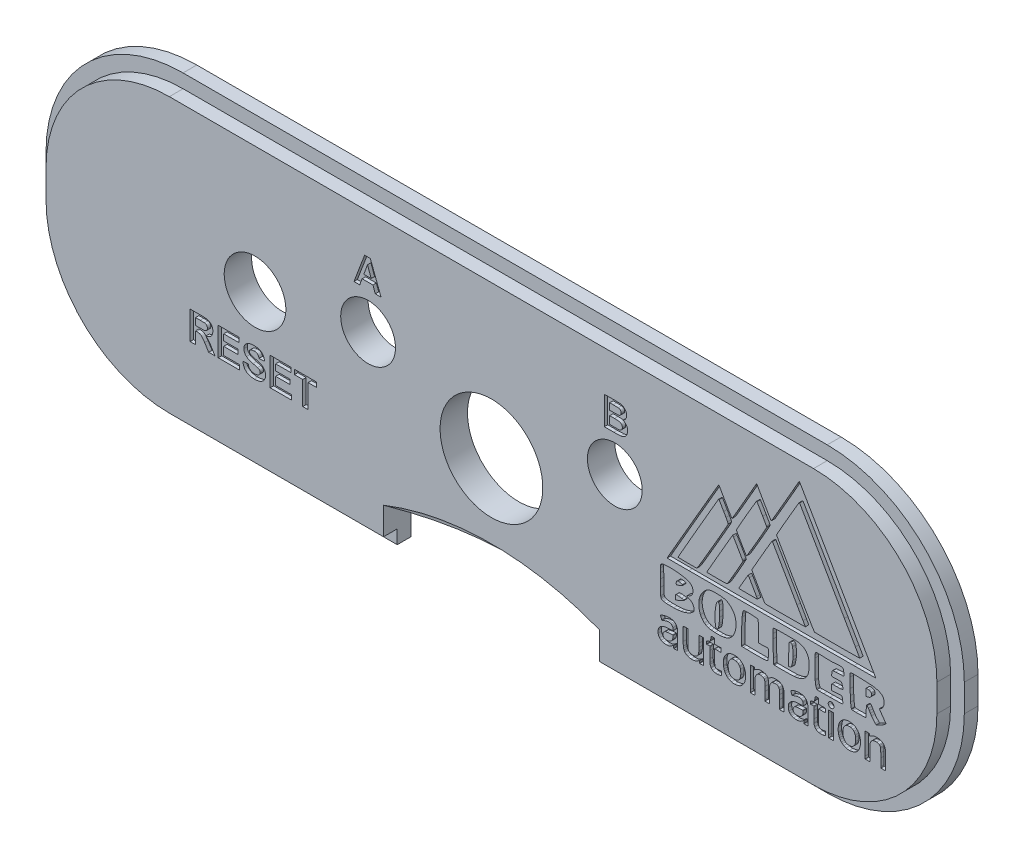
from build123d import *

# Parameters (mm, degrees)
SKETCH1_W           = 67
SKETCH1_H           = 22
BOSS_EXTRUDE1_DEPTH = 1
FILLET1_R           = 10
BOSS_EXTRUDE2_DEPTH = 1
SKETCH3_W           = 15.75
SKETCH3_H           = 6
CUT_EXTRUDE1_DEPTH  = 36.316426773
SKETCH112_R         = 3.75
SKETCH112_R_2       = 2
SKETCH112_R_3       = 2.25
CUT_EXTRUDE2_DEPTH  = 36.316426779
SKETCH113_R         = 0.210257683
CUT_EXTRUDE3_DEPTH  = 0.25
CUT_EXTRUDE4_DEPTH  = 0.25
CUT_EXTRUDE5_DEPTH  = 0.25
CUT_EXTRUDE6_DEPTH  = 0.25


with BuildPart() as part:
    # Sketch1 → Boss-Extrude1 (new body)
    with BuildSketch(Plane.XY):
        Rectangle(SKETCH1_W, SKETCH1_H)
    extrude(amount=BOSS_EXTRUDE1_DEPTH)

    # Fillet1
    fillet1_edges = [part.edges().sort_by_distance(p)[0] for p in [
        (33.5, 11, 0.5),
        (33.5, -11, 0.5),
        (-33.5, -11, 0.5),
        (-33.5, 11, 0.5),
    ]]
    fillet(fillet1_edges, radius=FILLET1_R)

    # Sketch2 → Boss-Extrude2 (add)
    with BuildSketch(Plane.XY.offset(1)):
        with BuildLine():
            Line((32.5, -1), (32.5, 1))
            ThreePointArc((32.5, 1), (29.863961031, 7.363961031), (23.5, 10))
            Line((23.5, 10), (-23.5, 10))
            ThreePointArc((-23.5, 10), (-29.863961031, 7.363961031), (-32.5, 1))
            Line((-32.5, 1), (-32.5, -1))
            ThreePointArc((-32.5, -1), (-29.863961031, -7.363961031), (-23.5, -10))
            Line((-23.5, -10), (23.5, -10))
            ThreePointArc((23.5, -10), (29.863961031, -7.363961031), (32.5, -1))
        make_face()
    extrude(amount=BOSS_EXTRUDE2_DEPTH)

    # Sketch3 → Cut-Extrude1 (cut, through all)
    with BuildSketch(Plane(origin=(0, 0, 0), x_dir=(-1, 0, 0), z_dir=(0, 0, -1))):
        with Locations((0, -11)):
            Rectangle(SKETCH3_W, SKETCH3_H)
    extrude(amount=-CUT_EXTRUDE1_DEPTH, mode=Mode.SUBTRACT)

    # Sketch109 → Cut-Revolve3 (revolve, cut)
    with BuildSketch(Plane.XY.offset(2)):
        with BuildLine():
            ThreePointArc((7.875, -8), (0, -6.5), (-7.875, -8))
            Line((-7.875, -8), (7.875, -8))
        make_face()
    revolve(axis=Axis((7.875, -8, 2), (1, 0, 0)), mode=Mode.SUBTRACT)

    # Sketch112 → Cut-Extrude2 (cut, through all)
    with BuildSketch(Plane(origin=(0, 0, 0), x_dir=(-1, 0, 0), z_dir=(0, 0, -1))):
        with Locations((0, -1.1)):
            Circle(SKETCH112_R)
        with Locations((9, 2.38)):
            Circle(SKETCH112_R_2)
        with Locations((-9, 2.38)):
            Circle(SKETCH112_R_2)
        with Locations((17.25, 0.8)):
            Circle(SKETCH112_R_3)
    extrude(amount=-CUT_EXTRUDE2_DEPTH, mode=Mode.SUBTRACT)

    # Sketch113 → Cut-Extrude3 (cut)
    # profile 1 of 18: a face of its own
    with BuildSketch(Plane.XY.offset(2)):
        with Locations((24.780315203, -4.303503244)):
            Circle(SKETCH113_R)
    # profile 2 of 18: a face of its own
    with BuildSketch(Plane.XY.offset(2)):
        with BuildLine():
            ThreePointArc((23.049845501, 7.678245368), (22.758677909, 8.180428061), (22.464101308, 8.680618675))
            ThreePointArc((22.464101308, 8.680618675), (22.387366163, 8.554969848), (22.314017727, 8.427314386))
            ThreePointArc((22.314017727, 8.427314386), (22.127685496, 8.103957731), (21.941876638, 7.780300049))
            ThreePointArc((21.941876638, 7.780300049), (21.425524765, 6.881044811), (20.907877871, 5.982534414))
            ThreePointArc((20.907877871, 5.982534414), (20.671880247, 5.576030409), (20.434248158, 5.170479705))
            ThreePointArc((20.434248158, 5.170479705), (20.431492638, 5.167197166), (20.427945366, 5.164792002))
            ThreePointArc((20.427945366, 5.164792002), (20.418461344, 5.16183197), (20.408527038, 5.161966281))
            ThreePointArc((20.408527038, 5.161966281), (20.399887072, 5.164682056), (20.392929167, 5.170479641))
            ThreePointArc((20.392929167, 5.170479641), (20.269899152, 5.377553166), (20.148491952, 5.585582301))
            ThreePointArc((20.148491952, 5.585582301), (20.01156015, 5.822720648), (19.87535079, 6.060274691))
            ThreePointArc((19.87535079, 6.060274691), (19.652722852, 6.449984328), (19.429810143, 6.839531146))
            ThreePointArc((19.429810143, 6.839531146), (19.391983714, 6.905596286), (19.350837419, 6.969646453))
            ThreePointArc((19.350837419, 6.969646453), (19.282773899, 6.859292434), (19.218090379, 6.746923868))
            ThreePointArc((19.218090379, 6.746923868), (19.053943705, 6.462625573), (18.890351435, 6.1780079))
            ThreePointArc((18.890351435, 6.1780079), (18.436011129, 5.387273326), (17.980708893, 4.597092236))
            ThreePointArc((17.980708893, 4.597092236), (17.773162093, 4.239557005), (17.564210823, 3.882840756))
            ThreePointArc((17.564210823, 3.882840756), (17.561946391, 3.880143367), (17.55903135, 3.878166983))
            ThreePointArc((17.55903135, 3.878166983), (17.543900523, 3.875858222), (17.530280053, 3.882840709))
            ThreePointArc((17.530280053, 3.882840709), (17.436305412, 4.042335789), (17.343643571, 4.202597128))
            ThreePointArc((17.343643571, 4.202597128), (17.160629832, 4.524491138), (16.979179984, 4.847269288))
            ThreePointArc((16.979179984, 4.847269288), (16.795587561, 5.16878465), (16.607990197, 5.487979786))
            ThreePointArc((16.607990197, 5.487979786), (16.605013154, 5.491472661), (16.60120477, 5.494033751))
            ThreePointArc((16.60120477, 5.494033751), (16.59106166, 5.497201972), (16.580435865, 5.497088849))
            ThreePointArc((16.580435865, 5.497088849), (16.571248735, 5.494197284), (16.563892975, 5.487979786))
            ThreePointArc((16.563892975, 5.487979786), (16.126596005, 4.738086822), (15.690327656, 3.987594966))
            ThreePointArc((15.690327656, 3.987594966), (14.385270023, 1.733934594), (13.085432414, -0.522740546))
            ThreePointArc((13.085432414, -0.522740546), (12.950618111, -0.757540735), (12.819339912, -0.994336131))
            ThreePointArc((12.819339912, -0.994336131), (13.611895245, -0.997597298), (14.404456981, -0.996901586))
            ThreePointArc((14.404456981, -0.996901586), (20.431219035, -0.989832356), (26.457969158, -0.975911807))
            ThreePointArc((26.457969158, -0.975911807), (27.250532569, -0.973847254), (28.043075822, -0.967829336))
            ThreePointArc((28.043075822, -0.967829336), (27.756524331, -0.462998818), (27.466545447, 0.039870802))
            ThreePointArc((27.466545447, 0.039870802), (25.261159121, 3.86077174), (23.049845501, 7.678245368))
        make_face()
        with BuildLine():
            ThreePointArc((22.458811081, 7.322466909), (22.449867884, 7.319645217), (22.442694388, 7.313605045))
            ThreePointArc((22.442694388, 7.313605045), (21.829796986, 6.264957665), (21.221893344, 5.213407516))
            ThreePointArc((21.221893344, 5.213407516), (21.071385429, 4.949134269), (20.922799856, 4.683775437))
            ThreePointArc((20.922799856, 4.683775437), (20.860507689, 4.571947862), (20.806045753, 4.456104786))
            ThreePointArc((20.806045753, 4.456104786), (20.943233516, 4.197335561), (21.088566058, 3.943051375))
            ThreePointArc((21.088566058, 3.943051375), (21.42523137, 3.354351924), (21.763906775, 2.766806567))
            ThreePointArc((21.763906775, 2.766806567), (22.168250803, 2.068845057), (22.574035951, 1.371720408))
            ThreePointArc((22.574035951, 1.371720408), (22.916478828, 0.786344405), (23.260921632, 0.202142947))
            ThreePointArc((23.260921632, 0.202142947), (23.409757612, -0.050143794), (23.566531864, -0.29757577))
            ThreePointArc((23.566531864, -0.29757577), (23.747131634, -0.307915403), (23.928021762, -0.309310636))
            ThreePointArc((23.928021762, -0.309310636), (24.338201158, -0.31209519), (24.748389445, -0.312773174))
            ThreePointArc((24.748389445, -0.312773174), (25.638548502, -0.31070025), (26.528688384, -0.304500848))
            ThreePointArc((26.528688384, -0.304500848), (26.699426594, -0.303011733), (26.870084745, -0.297575772))
            ThreePointArc((26.870084745, -0.297575772), (26.715749602, -0.02014957), (26.557878106, 0.255279594))
            ThreePointArc((26.557878106, 0.255279594), (26.156113926, 0.95662052), (25.753466674, 1.657454839))
            ThreePointArc((25.753466674, 1.657454839), (24.122331592, 4.487181646), (22.485478971, 7.313604996))
            ThreePointArc((22.485478971, 7.313604996), (22.482639295, 7.317018927), (22.478969468, 7.319519135))
            ThreePointArc((22.478969468, 7.319519135), (22.469125656, 7.322602684), (22.458811081, 7.322466909))
        make_face(mode=Mode.SUBTRACT)
        with BuildLine():
            ThreePointArc((19.345503414, 5.849538362), (19.336610334, 5.846749983), (19.329472055, 5.840757745))
            ThreePointArc((19.329472055, 5.840757745), (19.033673935, 5.34122978), (18.739816513, 4.840557701))
            ThreePointArc((18.739816513, 4.840557701), (18.304826043, 4.08620877), (17.877990197, 3.327215897))
            ThreePointArc((17.877990197, 3.327215897), (17.874952732, 3.319909058), (17.873522523, 3.312126347))
            ThreePointArc((17.873522523, 3.312126347), (17.874647226, 3.295246197), (17.879947878, 3.279180472))
            ThreePointArc((17.879947878, 3.279180472), (17.887220355, 3.263226414), (17.895629086, 3.247840897))
            ThreePointArc((17.895629086, 3.247840897), (18.029886709, 3.007623021), (18.165193963, 2.767994799))
            ThreePointArc((18.165193963, 2.767994799), (18.372131592, 2.41087226), (18.584938397, 2.05721571))
            ThreePointArc((18.584938397, 2.05721571), (18.588106931, 2.053563894), (18.59213079, 2.050883609))
            ThreePointArc((18.59213079, 2.050883609), (18.602787012, 2.04756975), (18.613946066, 2.04768039))
            ThreePointArc((18.613946066, 2.04768039), (18.623609895, 2.050708281), (18.631369435, 2.057215759))
            ThreePointArc((18.631369435, 2.057215759), (18.779822314, 2.306651889), (18.92789838, 2.556311895))
            ThreePointArc((18.92789838, 2.556311895), (19.222311126, 3.056685917), (19.513791609, 3.558773712))
            ThreePointArc((19.513791609, 3.558773712), (19.800876569, 4.063328846), (20.082851308, 4.570757564))
            ThreePointArc((20.082851308, 4.570757564), (20.087478781, 4.588082648), (20.084223962, 4.605717222))
            ThreePointArc((20.084223962, 4.605717222), (20.080704434, 4.615064084), (20.076427383, 4.624089477))
            ThreePointArc((20.076427383, 4.624089477), (20.066705137, 4.641690246), (20.056392975, 4.658952008))
            ThreePointArc((20.056392975, 4.658952008), (19.922712746, 4.897151251), (19.788211531, 5.134887883))
            ThreePointArc((19.788211531, 5.134887883), (19.582894561, 5.489410536), (19.372189715, 5.840757712))
            ThreePointArc((19.372189715, 5.840757712), (19.369280382, 5.844121586), (19.365580876, 5.846590094))
            ThreePointArc((19.365580876, 5.846590094), (19.355773838, 5.84964204), (19.345503414, 5.849538362))
        make_face(mode=Mode.SUBTRACT)
        with BuildLine():
            ThreePointArc((16.580883427, 4.597028523), (16.572183514, 4.594286596), (16.56521827, 4.588396603))
            ThreePointArc((16.56521827, 4.588396603), (16.219994077, 3.994943771), (15.875725751, 3.40093592))
            ThreePointArc((15.875725751, 3.40093592), (14.846465873, 1.616850806), (13.82221667, -0.170115663))
            ThreePointArc((13.82221667, -0.170115663), (13.715906727, -0.356332418), (13.613126209, -0.544520221))
            ThreePointArc((13.613126209, -0.544520221), (13.683753394, -0.549903661), (13.754568693, -0.551444438))
            ThreePointArc((13.754568693, -0.551444438), (14.121731529, -0.557912489), (14.488946898, -0.559717032))
            ThreePointArc((14.488946898, -0.559717032), (14.660732629, -0.559028257), (14.832497352, -0.556254922))
            ThreePointArc((14.832497352, -0.556254922), (14.913550734, -0.554326243), (14.994031864, -0.544520214))
            ThreePointArc((14.994031864, -0.544520214), (15.125963392, -0.339763292), (15.250085396, -0.130180247))
            ThreePointArc((15.250085396, -0.130180247), (15.53544512, 0.352237448), (15.818807109, 0.835831272))
            ThreePointArc((15.818807109, 0.835831272), (16.154089025, 1.411505989), (16.487925668, 1.98802003))
            ThreePointArc((16.487925668, 1.98802003), (16.76755679, 2.473877883), (17.045169735, 2.960891713))
            ThreePointArc((17.045169735, 2.960891713), (17.165765191, 3.172718447), (17.278267975, 3.388952008))
            ThreePointArc((17.278267975, 3.388952008), (17.258085583, 3.444720395), (17.231097855, 3.497532366))
            ThreePointArc((17.231097855, 3.497532366), (17.17129877, 3.610326452), (17.109582522, 3.722083067))
            ThreePointArc((17.109582522, 3.722083067), (17.02753467, 3.867460748), (16.944519159, 4.012288042))
            ThreePointArc((16.944519159, 4.012288042), (16.776680697, 4.300900473), (16.606937073, 4.588396536))
            ThreePointArc((16.606937073, 4.588396536), (16.604137145, 4.59171084), (16.600542153, 4.59413988))
            ThreePointArc((16.600542153, 4.59413988), (16.59094182, 4.597142873), (16.580883427, 4.597028523))
        make_face(mode=Mode.SUBTRACT)
        with BuildLine():
            ThreePointArc((20.47591664, 3.892453723), (20.466185214, 3.889388976), (20.458360972, 3.882841107))
            ThreePointArc((20.458360972, 3.882841107), (20.162982289, 3.383101263), (19.870990227, 2.881375129))
            ThreePointArc((19.870990227, 2.881375129), (19.437091664, 2.126390401), (19.006879086, 1.36929923))
            ThreePointArc((19.006879086, 1.36929923), (19.001193262, 1.347250619), (19.006879086, 1.325202008))
            ThreePointArc((19.006879086, 1.325202008), (19.113873055, 1.137624871), (19.220763942, 0.949988973))
            ThreePointArc((19.220763942, 0.949988973), (19.455826679, 0.538894572), (19.692698596, 0.128839951))
            ThreePointArc((19.692698596, 0.128839951), (19.781192233, -0.021317331), (19.871506168, -0.170386865))
            ThreePointArc((19.871506168, -0.170386865), (19.912137134, -0.236265033), (19.959379086, -0.29757577))
            ThreePointArc((19.959379086, -0.29757577), (20.121234105, -0.307885649), (20.283410637, -0.309339267))
            ThreePointArc((20.283410637, -0.309339267), (20.648756669, -0.312126619), (21.014112705, -0.312804159))
            ThreePointArc((21.014112705, -0.312804159), (21.805844941, -0.31072145), (22.597555515, -0.304505554))
            ThreePointArc((22.597555515, -0.304505554), (22.749477564, -0.303008545), (22.901309822, -0.297575773))
            ThreePointArc((22.901309822, -0.297575773), (22.818593337, -0.143656099), (22.732345723, 0.008313083))
            ThreePointArc((22.732345723, 0.008313083), (22.513591946, 0.394077166), (22.293938436, 0.779329652))
            ThreePointArc((22.293938436, 0.779329652), (21.402503968, 2.332865722), (20.50489257, 3.882841047))
            ThreePointArc((20.50489257, 3.882841047), (20.501801078, 3.886547566), (20.497810496, 3.889262498))
            ThreePointArc((20.497810496, 3.889262498), (20.487118341, 3.892606017), (20.47591664, 3.892453723))
        make_face(mode=Mode.SUBTRACT)
        with BuildLine():
            ThreePointArc((17.661789383, 2.755397702), (17.635234021, 2.799398629), (17.605450978, 2.841282268))
            ThreePointArc((17.605450978, 2.841282268), (17.502554079, 2.672245493), (17.403014032, 2.501210459))
            ThreePointArc((17.403014032, 2.501210459), (16.651222637, 1.205655827), (15.905351977, -0.093316484))
            ThreePointArc((15.905351977, -0.093316484), (15.807035105, -0.26504582), (15.712135411, -0.438686887))
            ThreePointArc((15.712135411, -0.438686887), (15.78774731, -0.444076879), (15.863535566, -0.445610375))
            ThreePointArc((15.863535566, -0.445610375), (16.256740765, -0.452071812), (16.649994924, -0.453873123))
            ThreePointArc((16.649994924, -0.453873123), (16.833637799, -0.453184847), (17.017261019, -0.450411379))
            ThreePointArc((17.017261019, -0.450411379), (17.103248065, -0.448539277), (17.188689316, -0.438686887))
            ThreePointArc((17.188689316, -0.438686887), (17.243643113, -0.364772321), (17.291757005, -0.286233563))
            ThreePointArc((17.291757005, -0.286233563), (17.401472166, -0.104692414), (17.509156207, 0.078060842))
            ThreePointArc((17.509156207, 0.078060842), (17.928406599, 0.808757896), (18.336601308, 1.545688119))
            ThreePointArc((18.336601308, 1.545688119), (18.340148725, 1.554711021), (18.341536391, 1.5643064))
            ThreePointArc((18.341536391, 1.5643064), (18.33898022, 1.58505567), (18.331151933, 1.604440824))
            ThreePointArc((18.331151933, 1.604440824), (18.321123155, 1.62383262), (18.310142975, 1.642702008))
            ThreePointArc((18.310142975, 1.642702008), (17.989511184, 2.201115484), (17.661789383, 2.755397702))
        make_face(mode=Mode.SUBTRACT)
        with BuildLine():
            ThreePointArc((18.810033335, 0.761566377), (18.773826796, 0.823460091), (18.734370916, 0.883334783))
            ThreePointArc((18.734370916, 0.883334783), (18.694361706, 0.823489132), (18.657588664, 0.761602281))
            ThreePointArc((18.657588664, 0.761602281), (18.384249301, 0.297270627), (18.116830144, -0.170495648))
            ThreePointArc((18.116830144, -0.170495648), (18.081357463, -0.233137766), (18.049262467, -0.297575776))
            ThreePointArc((18.049262467, -0.297575776), (18.120799467, -0.302149046), (18.192478564, -0.30290017))
            ThreePointArc((18.192478564, -0.30290017), (18.728960401, -0.306316462), (19.265442197, -0.302893827))
            ThreePointArc((19.265442197, -0.302893827), (19.337130188, -0.302141726), (19.408676577, -0.297575776))
            ThreePointArc((19.408676577, -0.297575776), (19.377152893, -0.233160047), (19.342247015, -0.170512552))
            ThreePointArc((19.342247015, -0.170512552), (19.079107936, 0.297221494), (18.810033335, 0.761566377))
        make_face(mode=Mode.SUBTRACT)
    # profile 3 of 18: a face of its own
    with BuildSketch(Plane.XY.offset(2)):
        with BuildLine():
            ThreePointArc((16.54864783, -1.430110117), (16.318085848, -1.427390751), (16.087642975, -1.435284103))
            ThreePointArc((16.087642975, -1.435284103), (16.062071872, -1.437423658), (16.036670805, -1.441063))
            ThreePointArc((16.036670805, -1.441063), (15.986229338, -1.452170442), (15.936927291, -1.467566058))
            ThreePointArc((15.936927291, -1.467566058), (15.840555088, -1.505495625), (15.747198544, -1.550337675))
            ThreePointArc((15.747198544, -1.550337675), (15.681080254, -1.590437329), (15.620212419, -1.638131325))
            ThreePointArc((15.620212419, -1.638131325), (15.588517577, -1.668427053), (15.557646252, -1.699561527))
            ThreePointArc((15.557646252, -1.699561527), (15.441623299, -1.831444333), (15.337990197, -1.973270214))
            ThreePointArc((15.337990197, -1.973270214), (15.307240245, -2.02294755), (15.280343451, -2.07481237))
            ThreePointArc((15.280343451, -2.07481237), (15.244950925, -2.155331781), (15.214517975, -2.237853547))
            ThreePointArc((15.214517975, -2.237853547), (15.172526042, -2.37728612), (15.143962419, -2.52007577))
            ThreePointArc((15.143962419, -2.52007577), (15.137645596, -2.942151381), (15.249795753, -3.349103547))
            ThreePointArc((15.249795753, -3.349103547), (15.311169127, -3.472403151), (15.38660922, -3.587634552))
            ThreePointArc((15.38660922, -3.587634552), (15.446524231, -3.657423414), (15.514379086, -3.719520214))
            ThreePointArc((15.514379086, -3.719520214), (15.536600194, -3.736991513), (15.558976775, -3.754263242))
            ThreePointArc((15.558976775, -3.754263242), (15.604732079, -3.78774141), (15.651980791, -3.819076609))
            ThreePointArc((15.651980791, -3.819076609), (15.732903734, -3.861436518), (15.819126026, -3.891579524))
            ThreePointArc((15.819126026, -3.891579524), (15.921942201, -3.916262927), (16.026482211, -3.932131836))
            ThreePointArc((16.026482211, -3.932131836), (16.166871452, -3.946426335), (16.307760069, -3.954418164))
            ThreePointArc((16.307760069, -3.954418164), (16.49680576, -3.958469058), (16.685882319, -3.956292476))
            ThreePointArc((16.685882319, -3.956292476), (16.806132801, -3.948001486), (16.925490197, -3.931186881))
            ThreePointArc((16.925490197, -3.931186881), (17.077570714, -3.894399526), (17.225351308, -3.842992436))
            ThreePointArc((17.225351308, -3.842992436), (17.317615456, -3.796858608), (17.401740197, -3.737159103))
            ThreePointArc((17.401740197, -3.737159103), (17.467828817, -3.678665771), (17.530345825, -3.616369711))
            ThreePointArc((17.530345825, -3.616369711), (17.606272326, -3.523093631), (17.669423001, -3.420735179))
            ThreePointArc((17.669423001, -3.420735179), (17.72336381, -3.308564239), (17.766728026, -3.191896011))
            ThreePointArc((17.766728026, -3.191896011), (17.806929138, -3.042074176), (17.832930914, -2.889147333))
            ThreePointArc((17.832930914, -2.889147333), (17.844169767, -2.714019744), (17.835272873, -2.538757571))
            ThreePointArc((17.835272873, -2.538757571), (17.820261057, -2.41689089), (17.79607035, -2.296509612))
            ThreePointArc((17.79607035, -2.296509612), (17.766001624, -2.203975445), (17.728059642, -2.114381325))
            ThreePointArc((17.728059642, -2.114381325), (17.679786204, -2.019123885), (17.622226308, -1.929172992))
            ThreePointArc((17.622226308, -1.929172992), (17.527035709, -1.814388115), (17.418827318, -1.711783231))
            ThreePointArc((17.418827318, -1.711783231), (17.37348806, -1.671301092), (17.326730665, -1.632465567))
            ThreePointArc((17.326730665, -1.632465567), (17.277603114, -1.597580108), (17.225351308, -1.56757577))
            ThreePointArc((17.225351308, -1.56757577), (17.154486158, -1.535118961), (17.081853786, -1.5068373))
            ThreePointArc((17.081853786, -1.5068373), (16.969853461, -1.473738341), (16.854934642, -1.452922992))
            ThreePointArc((16.854934642, -1.452922992), (16.702023265, -1.438401317), (16.54864783, -1.430110117))
        make_face()
        with BuildLine():
            ThreePointArc((16.541620365, -1.906281349), (16.526559818, -1.902251426), (16.510976308, -1.902714659))
            ThreePointArc((16.510976308, -1.902714659), (16.501421635, -1.907569103), (16.493128012, -1.91435683))
            ThreePointArc((16.493128012, -1.91435683), (16.481270849, -1.926216075), (16.470358778, -1.938950307))
            ThreePointArc((16.470358778, -1.938950307), (16.446488592, -1.972383602), (16.426632285, -2.008346056))
            ThreePointArc((16.426632285, -2.008346056), (16.419366543, -2.025753519), (16.413962419, -2.04382577))
            ThreePointArc((16.413962419, -2.04382577), (16.356275961, -2.345047206), (16.318580028, -2.649417208))
            ThreePointArc((16.318580028, -2.649417208), (16.308868649, -2.792794385), (16.305311977, -2.936456057))
            ThreePointArc((16.305311977, -2.936456057), (16.308903678, -3.07078428), (16.317692787, -3.204872771))
            ThreePointArc((16.317692787, -3.204872771), (16.329547044, -3.338820592), (16.343406864, -3.47257577))
            ThreePointArc((16.343406864, -3.47257577), (16.351422831, -3.525502793), (16.364754883, -3.577346616))
            ThreePointArc((16.364754883, -3.577346616), (16.378357366, -3.609842719), (16.396323531, -3.640145214))
            ThreePointArc((16.396323531, -3.640145214), (16.401771647, -3.64635661), (16.40824416, -3.651491782))
            ThreePointArc((16.40824416, -3.651491782), (16.441198239, -3.662925732), (16.475698531, -3.657784103))
            ThreePointArc((16.475698531, -3.657784103), (16.492882291, -3.647316261), (16.506962548, -3.632942545))
            ThreePointArc((16.506962548, -3.632942545), (16.524441761, -3.606929256), (16.537434642, -3.578409103))
            ThreePointArc((16.537434642, -3.578409103), (16.570279202, -3.483136912), (16.590351308, -3.384381325))
            ThreePointArc((16.590351308, -3.384381325), (16.599163341, -3.314077519), (16.607625157, -3.243730702))
            ThreePointArc((16.607625157, -3.243730702), (16.629766488, -3.03230171), (16.646099394, -2.82034489))
            ThreePointArc((16.646099394, -2.82034489), (16.652861653, -2.627800425), (16.650671924, -2.435149694))
            ThreePointArc((16.650671924, -2.435149694), (16.641069008, -2.252516585), (16.625629086, -2.070284103))
            ThreePointArc((16.625629086, -2.070284103), (16.61123457, -2.001586905), (16.581531864, -1.937992436))
            ThreePointArc((16.581531864, -1.937992436), (16.563872732, -1.919246376), (16.541620365, -1.906281349))
        make_face(mode=Mode.SUBTRACT)
    # profile 4 of 18: a face of its own
    with BuildSketch(Plane.XY.offset(2)):
        with BuildLine():
            ThreePointArc((13.537082235, -1.514108775), (13.42781367, -1.504235242), (13.318337419, -1.497020214))
            ThreePointArc((13.318337419, -1.497020214), (13.187167308, -1.492737566), (13.055946434, -1.490496675))
            ThreePointArc((13.055946434, -1.490496675), (12.871858272, -1.49256558), (12.68800136, -1.502019016))
            ThreePointArc((12.68800136, -1.502019016), (12.601630582, -1.5107095), (12.515767975, -1.523478547))
            ThreePointArc((12.515767975, -1.523478547), (12.470385943, -1.538146956), (12.429890692, -1.563342703))
            ThreePointArc((12.429890692, -1.563342703), (12.378206364, -1.613089493), (12.339379086, -1.673409103))
            ThreePointArc((12.339379086, -1.673409103), (12.329754899, -1.708614297), (12.325424803, -1.744853515))
            ThreePointArc((12.325424803, -1.744853515), (12.321323082, -1.805592625), (12.319358925, -1.866438377))
            ThreePointArc((12.319358925, -1.866438377), (12.318242949, -2.020276639), (12.320191775, -2.174106605))
            ThreePointArc((12.320191775, -2.174106605), (12.322315755, -2.374468851), (12.323013437, -2.574841139))
            ThreePointArc((12.323013437, -2.574841139), (12.325297572, -2.832466675), (12.329409487, -3.090069521))
            ThreePointArc((12.329409487, -3.090069521), (12.336800925, -3.347541587), (12.348198531, -3.604867436))
            ThreePointArc((12.348198531, -3.604867436), (12.351196664, -3.642683916), (12.356486393, -3.680248443))
            ThreePointArc((12.356486393, -3.680248443), (12.365809871, -3.716583708), (12.380231642, -3.75121305))
            ThreePointArc((12.380231642, -3.75121305), (12.40097723, -3.780835277), (12.428448065, -3.804355671))
            ThreePointArc((12.428448065, -3.804355671), (12.461160074, -3.821291183), (12.496150805, -3.832803608))
            ThreePointArc((12.496150805, -3.832803608), (12.532358432, -3.842533993), (12.568684642, -3.851811881))
            ThreePointArc((12.568684642, -3.851811881), (12.669167374, -3.874860821), (12.771531864, -3.887089659))
            ThreePointArc((12.771531864, -3.887089659), (12.877300021, -3.892906321), (12.983132313, -3.8974077))
            ThreePointArc((12.983132313, -3.8974077), (13.14193024, -3.899798477), (13.300698531, -3.895909103))
            ThreePointArc((13.300698531, -3.895909103), (13.433873941, -3.888789348), (13.566984077, -3.880538721))
            ThreePointArc((13.566984077, -3.880538721), (13.699630969, -3.868355863), (13.831677235, -3.850822938))
            ThreePointArc((13.831677235, -3.850822938), (13.959559096, -3.82578392), (14.085334003, -3.79170467))
            ThreePointArc((14.085334003, -3.79170467), (14.266792939, -3.728770821), (14.443545158, -3.653626505))
            ThreePointArc((14.443545158, -3.653626505), (14.512477639, -3.616698719), (14.576789189, -3.572208573))
            ThreePointArc((14.576789189, -3.572208573), (14.639280118, -3.521132394), (14.698153361, -3.465925207))
            ThreePointArc((14.698153361, -3.465925207), (14.722550495, -3.439947528), (14.745378866, -3.412581027))
            ThreePointArc((14.745378866, -3.412581027), (14.760970686, -3.390588599), (14.773545753, -3.366742436))
            ThreePointArc((14.773545753, -3.366742436), (14.780194977, -3.346226484), (14.78423412, -3.325041541))
            ThreePointArc((14.78423412, -3.325041541), (14.786181329, -3.280323966), (14.781378253, -3.235822465))
            ThreePointArc((14.781378253, -3.235822465), (14.773671918, -3.190924194), (14.764726308, -3.146256325))
            ThreePointArc((14.764726308, -3.146256325), (14.726651909, -3.028973439), (14.660098098, -2.925168209))
            ThreePointArc((14.660098098, -2.925168209), (14.622552375, -2.882974416), (14.579517975, -2.846395214))
            ThreePointArc((14.579517975, -2.846395214), (14.551234498, -2.828132075), (14.521867649, -2.811667402))
            ThreePointArc((14.521867649, -2.811667402), (14.49163946, -2.796541422), (14.460948253, -2.782378495))
            ThreePointArc((14.460948253, -2.782378495), (14.429917435, -2.768671115), (14.398867934, -2.755006109))
            ThreePointArc((14.398867934, -2.755006109), (14.368092586, -2.740957474), (14.337734838, -2.726027862))
            ThreePointArc((14.337734838, -2.726027862), (14.308188204, -2.709839266), (14.279657112, -2.691921371))
            ThreePointArc((14.279657112, -2.691921371), (14.275942541, -2.68848961), (14.273207358, -2.68423593))
            ThreePointArc((14.273207358, -2.68423593), (14.269864742, -2.67320864), (14.269994885, -2.661686606))
            ThreePointArc((14.269994885, -2.661686606), (14.273093391, -2.651535756), (14.279656809, -2.643195369))
            ThreePointArc((14.279656809, -2.643195369), (14.30201648, -2.629246694), (14.32533648, -2.616970781))
            ThreePointArc((14.32533648, -2.616970781), (14.349432238, -2.605925769), (14.373912434, -2.595761231))
            ThreePointArc((14.373912434, -2.595761231), (14.398685885, -2.585995411), (14.423461058, -2.576233959))
            ThreePointArc((14.423461058, -2.576233959), (14.447949898, -2.566081086), (14.472058739, -2.555056206))
            ThreePointArc((14.472058739, -2.555056206), (14.525731037, -2.523074459), (14.572522909, -2.48167315))
            ThreePointArc((14.572522909, -2.48167315), (14.608531607, -2.440465883), (14.641254086, -2.396603547))
            ThreePointArc((14.641254086, -2.396603547), (14.653538926, -2.378780088), (14.66470064, -2.360232605))
            ThreePointArc((14.66470064, -2.360232605), (14.677750434, -2.330838889), (14.685351308, -2.299589659))
            ThreePointArc((14.685351308, -2.299589659), (14.691058696, -2.239650141), (14.694667762, -2.179547772))
            ThreePointArc((14.694667762, -2.179547772), (14.694140382, -2.08942414), (14.685351308, -1.999728547))
            ThreePointArc((14.685351308, -1.999728547), (14.682175403, -1.984325957), (14.677728446, -1.969241172))
            ThreePointArc((14.677728446, -1.969241172), (14.66565807, -1.939793732), (14.650312761, -1.911912428))
            ThreePointArc((14.650312761, -1.911912428), (14.633110915, -1.884893962), (14.614795753, -1.858617436))
            ThreePointArc((14.614795753, -1.858617436), (14.570454985, -1.805944315), (14.517781864, -1.761603547))
            ThreePointArc((14.517781864, -1.761603547), (14.484441841, -1.738697771), (14.450328709, -1.716960111))
            ThreePointArc((14.450328709, -1.716960111), (14.397158063, -1.688076537), (14.341392975, -1.664589659))
            ThreePointArc((14.341392975, -1.664589659), (14.149445365, -1.607762043), (13.953337419, -1.56757577))
            ThreePointArc((13.953337419, -1.56757577), (13.745640268, -1.537491178), (13.537082235, -1.514108775))
        make_face()
        with BuildLine():
            ThreePointArc((13.897311858, -2.110200109), (13.816590435, -2.080740678), (13.732851308, -2.061464659))
            ThreePointArc((13.732851308, -2.061464659), (13.702714182, -2.056239031), (13.672369046, -2.052401548))
            ThreePointArc((13.672369046, -2.052401548), (13.642039363, -2.051359984), (13.611797963, -2.053896177))
            ThreePointArc((13.611797963, -2.053896177), (13.526684971, -2.098491372), (13.48561463, -2.185360124))
            ThreePointArc((13.48561463, -2.185360124), (13.481747194, -2.222466936), (13.48189898, -2.259774436))
            ThreePointArc((13.48189898, -2.259774436), (13.483658549, -2.297333979), (13.485906864, -2.334867436))
            ThreePointArc((13.485906864, -2.334867436), (13.488395133, -2.343250434), (13.494062318, -2.349909948))
            ThreePointArc((13.494062318, -2.349909948), (13.498491565, -2.352349457), (13.503545753, -2.352506325))
            ThreePointArc((13.503545753, -2.352506325), (13.591552365, -2.320236451), (13.6791481, -2.286867369))
            ThreePointArc((13.6791481, -2.286867369), (13.808777099, -2.232689991), (13.935698809, -2.172442622))
            ThreePointArc((13.935698809, -2.172442622), (13.939252954, -2.169708129), (13.941846513, -2.166049871))
            ThreePointArc((13.941846513, -2.166049871), (13.945050782, -2.155987637), (13.944874345, -2.145429001))
            ThreePointArc((13.944874345, -2.145429001), (13.941955053, -2.136318088), (13.935698468, -2.129080261))
            ThreePointArc((13.935698468, -2.129080261), (13.91670581, -2.119232235), (13.897311858, -2.110200109))
        make_face(mode=Mode.SUBTRACT)
        with BuildLine():
            ThreePointArc((13.646529053, -2.976793724), (13.561770456, -2.974358889), (13.477087419, -2.978686881))
            ThreePointArc((13.477087419, -2.978686881), (13.47081862, -2.979932035), (13.464825437, -2.982152402))
            ThreePointArc((13.464825437, -2.982152402), (13.444021823, -2.99864004), (13.432990197, -3.022784103))
            ThreePointArc((13.432990197, -3.022784103), (13.427510306, -3.080717563), (13.425928877, -3.138888124))
            ThreePointArc((13.425928877, -3.138888124), (13.427773955, -3.226424985), (13.432990197, -3.31382577))
            ThreePointArc((13.432990197, -3.31382577), (13.435550527, -3.322238788), (13.441215435, -3.328965078))
            ThreePointArc((13.441215435, -3.328965078), (13.445611186, -3.331386404), (13.450629086, -3.331464659))
            ThreePointArc((13.450629086, -3.331464659), (13.566874988, -3.284953025), (13.682602684, -3.237166604))
            ThreePointArc((13.682602684, -3.237166604), (13.854491832, -3.161626559), (14.023893317, -3.080661661))
            ThreePointArc((14.023893317, -3.080661661), (14.02710971, -3.078183358), (14.029442707, -3.074860062))
            ThreePointArc((14.029442707, -3.074860062), (14.032430747, -3.065638692), (14.032403187, -3.05594533))
            ThreePointArc((14.032403187, -3.05594533), (14.029792299, -3.048074912), (14.02389291, -3.042247611))
            ThreePointArc((14.02389291, -3.042247611), (13.946140335, -3.018947392), (13.866623831, -3.002653566))
            ThreePointArc((13.866623831, -3.002653566), (13.756912436, -2.986863983), (13.646529053, -2.976793724))
        make_face(mode=Mode.SUBTRACT)
    # profile 5 of 18: a face of its own
    with BuildSketch(Plane.XY.offset(2)):
        with BuildLine():
            ThreePointArc((18.621683055, -1.492513338), (18.527521879, -1.497380712), (18.433615197, -1.505839659))
            ThreePointArc((18.433615197, -1.505839659), (18.418885498, -1.509536234), (18.405637297, -1.516960107))
            ThreePointArc((18.405637297, -1.516960107), (18.393848016, -1.527685513), (18.384079082, -1.540278741))
            ThreePointArc((18.384079082, -1.540278741), (18.375161392, -1.555389972), (18.367690372, -1.571266318))
            ThreePointArc((18.367690372, -1.571266318), (18.361057138, -1.588184337), (18.355220989, -1.605393594))
            ThreePointArc((18.355220989, -1.605393594), (18.331850352, -1.690682176), (18.314901156, -1.777475341))
            ThreePointArc((18.314901156, -1.777475341), (18.30106026, -1.883914941), (18.292504086, -1.990909103))
            ThreePointArc((18.292504086, -1.990909103), (18.250256376, -2.88771854), (18.251907973, -3.785521028))
            ThreePointArc((18.251907973, -3.785521028), (18.252970542, -3.818750125), (18.257316204, -3.851710969))
            ThreePointArc((18.257316204, -3.851710969), (18.314439126, -3.856708301), (18.371760247, -3.858221801))
            ThreePointArc((18.371760247, -3.858221801), (18.513172104, -3.861851918), (18.654605364, -3.864521059))
            ThreePointArc((18.654605364, -3.864521059), (19.223192313, -3.870489871), (19.791809642, -3.86945077))
            ThreePointArc((19.791809642, -3.86945077), (19.947552957, -3.857223424), (20.100490197, -3.825353547))
            ThreePointArc((20.100490197, -3.825353547), (20.131275232, -3.814003776), (20.159442479, -3.797176957))
            ThreePointArc((20.159442479, -3.797176957), (20.1726504, -3.782220761), (20.179865197, -3.763617436))
            ThreePointArc((20.179865197, -3.763617436), (20.1877629, -3.692605069), (20.193842035, -3.62141396))
            ThreePointArc((20.193842035, -3.62141396), (20.201347743, -3.478533225), (20.203391492, -3.33547008))
            ThreePointArc((20.203391492, -3.33547008), (20.201809004, -3.192328259), (20.197504086, -3.049242436))
            ThreePointArc((20.197504086, -3.049242436), (20.196628905, -3.042871195), (20.194633746, -3.036757441))
            ThreePointArc((20.194633746, -3.036757441), (20.178172557, -3.015536194), (20.153406864, -3.005145214))
            ThreePointArc((20.153406864, -3.005145214), (20.090796101, -3.003937984), (20.028180855, -3.004884595))
            ThreePointArc((20.028180855, -3.004884595), (19.965519055, -3.007426308), (19.902907569, -3.010998884))
            ThreePointArc((19.902907569, -3.010998884), (19.840271146, -3.015046094), (19.777629231, -3.019007372))
            ThreePointArc((19.777629231, -3.019007372), (19.715034708, -3.022320275), (19.652388068, -3.024429348))
            ThreePointArc((19.652388068, -3.024429348), (19.589791895, -3.024770137), (19.527226308, -3.022784103))
            ThreePointArc((19.527226308, -3.022784103), (19.51503113, -3.018827484), (19.5059591, -3.009767934))
            ThreePointArc((19.5059591, -3.009767934), (19.4959741, -2.990863975), (19.491948531, -2.969867436))
            ThreePointArc((19.491948531, -2.969867436), (19.486455457, -2.829686225), (19.483131427, -2.689436817))
            ThreePointArc((19.483131427, -2.689436817), (19.481325676, -2.54909535), (19.480389695, -2.408745387))
            ThreePointArc((19.480389695, -2.408745387), (19.479673864, -2.26839132), (19.478528738, -2.1280401))
            ThreePointArc((19.478528738, -2.1280401), (19.4763058, -1.987784973), (19.472353956, -1.84756791))
            ThreePointArc((19.472353956, -1.84756791), (19.466025049, -1.707487109), (19.456670753, -1.56757577))
            ThreePointArc((19.456670753, -1.56757577), (19.454706094, -1.559117564), (19.450397708, -1.551578403))
            ThreePointArc((19.450397708, -1.551578403), (19.443964767, -1.544902148), (19.436398664, -1.539544053))
            ThreePointArc((19.436398664, -1.539544053), (19.427227769, -1.534811331), (19.417598642, -1.531098664))
            ThreePointArc((19.417598642, -1.531098664), (19.397695759, -1.52597396), (19.377295753, -1.523478547))
            ThreePointArc((19.377295753, -1.523478547), (19.282925145, -1.517436397), (19.188578457, -1.51103158))
            ThreePointArc((19.188578457, -1.51103158), (19.094062919, -1.504744489), (18.99950822, -1.499076753))
            ThreePointArc((18.99950822, -1.499076753), (18.905000242, -1.494525788), (18.810428574, -1.491581521))
            ThreePointArc((18.810428574, -1.491581521), (18.716049389, -1.490745801), (18.621683055, -1.492513338))
        make_face()
    # profile 6 of 18: a face of its own
    with BuildSketch(Plane.XY.offset(2)):
        with BuildLine():
            ThreePointArc((25.145212419, -1.505839659), (25.193134744, -1.504247201), (25.241035888, -1.502110498))
            ThreePointArc((25.241035888, -1.502110498), (25.289203045, -1.499901493), (25.33738765, -1.498113038))
            ThreePointArc((25.33738765, -1.498113038), (25.385417487, -1.497231777), (25.433452676, -1.497744047))
            ThreePointArc((25.433452676, -1.497744047), (25.48102411, -1.500130513), (25.528415942, -1.504900294))
            ThreePointArc((25.528415942, -1.504900294), (25.575271228, -1.512526409), (25.621462419, -1.523478547))
            ThreePointArc((25.621462419, -1.523478547), (25.634031489, -1.528983511), (25.644571208, -1.537769891))
            ThreePointArc((25.644571208, -1.537769891), (25.653109296, -1.549350899), (25.659507325, -1.562238254))
            ThreePointArc((25.659507325, -1.562238254), (25.664882727, -1.577327237), (25.66906266, -1.592790113))
            ThreePointArc((25.66906266, -1.592790113), (25.672687011, -1.609030814), (25.676029099, -1.625331941))
            ThreePointArc((25.676029099, -1.625331941), (25.679308417, -1.640623011), (25.683198531, -1.655770214))
            ThreePointArc((25.683198531, -1.655770214), (25.71065244, -1.769383511), (25.727295753, -1.88507577))
            ThreePointArc((25.727295753, -1.88507577), (25.730604344, -1.930522797), (25.729559562, -1.976078121))
            ThreePointArc((25.729559562, -1.976078121), (25.728143207, -1.988693114), (25.725621113, -2.001134301))
            ThreePointArc((25.725621113, -2.001134301), (25.722749191, -2.009507649), (25.717879804, -2.01690021))
            ThreePointArc((25.717879804, -2.01690021), (25.686720925, -2.023347783), (25.65495635, -2.025207535))
            ThreePointArc((25.65495635, -2.025207535), (25.58232764, -2.028991215), (25.50965689, -2.031856149))
            ThreePointArc((25.50965689, -2.031856149), (25.311554679, -2.03877841), (25.113547262, -2.048023217))
            ThreePointArc((25.113547262, -2.048023217), (25.023469135, -2.053707799), (24.933545753, -2.061464659))
            ThreePointArc((24.933545753, -2.061464659), (24.907185216, -2.067096709), (24.883172405, -2.079343458))
            ThreePointArc((24.883172405, -2.079343458), (24.870693439, -2.09061456), (24.862990197, -2.105561881))
            ThreePointArc((24.862990197, -2.105561881), (24.841818235, -2.202000403), (24.830321522, -2.300063984))
            ThreePointArc((24.830321522, -2.300063984), (24.82751774, -2.36594298), (24.827712419, -2.431881325))
            ThreePointArc((24.827712419, -2.431881325), (24.830994045, -2.442979845), (24.838017377, -2.452178705))
            ThreePointArc((24.838017377, -2.452178705), (24.853576773, -2.462684266), (24.871809642, -2.467159103))
            ThreePointArc((24.871809642, -2.467159103), (24.977640496, -2.468434039), (25.083439391, -2.465537671))
            ThreePointArc((25.083439391, -2.465537671), (25.189269096, -2.460489223), (25.29517204, -2.457330152))
            ThreePointArc((25.29517204, -2.457330152), (25.348081255, -2.457092818), (25.400976308, -2.458339659))
            ThreePointArc((25.400976308, -2.458339659), (25.442626098, -2.461763382), (25.483430152, -2.470788687))
            ThreePointArc((25.483430152, -2.470788687), (25.509226346, -2.480287852), (25.533267975, -2.493617436))
            ThreePointArc((25.533267975, -2.493617436), (25.548708874, -2.507147734), (25.561119135, -2.523502421))
            ThreePointArc((25.561119135, -2.523502421), (25.575062244, -2.55205088), (25.586184642, -2.581811881))
            ThreePointArc((25.586184642, -2.581811881), (25.618113154, -2.688381259), (25.646056026, -2.796064396))
            ThreePointArc((25.646056026, -2.796064396), (25.652365709, -2.823597381), (25.657921588, -2.851292319))
            ThreePointArc((25.657921588, -2.851292319), (25.660178938, -2.86401333), (25.659964532, -2.876931293))
            ThreePointArc((25.659964532, -2.876931293), (25.651498301, -2.882269617), (25.642069188, -2.885626195))
            ThreePointArc((25.642069188, -2.885626195), (25.569040626, -2.904971445), (25.494892428, -2.919443983))
            ThreePointArc((25.494892428, -2.919443983), (25.470042569, -2.923076363), (25.445073531, -2.925770214))
            ThreePointArc((25.445073531, -2.925770214), (25.325198113, -2.931707521), (25.205188153, -2.933432787))
            ThreePointArc((25.205188153, -2.933432787), (25.085093408, -2.933236942), (24.965023863, -2.935704867))
            ThreePointArc((24.965023863, -2.935704867), (24.905129319, -2.938651909), (24.845351308, -2.943409103))
            ThreePointArc((24.845351308, -2.943409103), (24.834455448, -2.947171955), (24.825418201, -2.954327862))
            ThreePointArc((24.825418201, -2.954327862), (24.815112184, -2.969699045), (24.810073531, -2.987506325))
            ThreePointArc((24.810073531, -2.987506325), (24.800487025, -3.123366383), (24.796326402, -3.259500676))
            ThreePointArc((24.796326402, -3.259500676), (24.796247966, -3.293923434), (24.796997687, -3.328338115))
            ThreePointArc((24.796997687, -3.328338115), (24.797581505, -3.343622889), (24.800796795, -3.358577055))
            ThreePointArc((24.800796795, -3.358577055), (24.841269149, -3.359614626), (24.881703348, -3.357574149))
            ThreePointArc((24.881703348, -3.357574149), (25.085483074, -3.346812282), (25.289266855, -3.336127479))
            ThreePointArc((25.289266855, -3.336127479), (25.383602358, -3.331676426), (25.477984057, -3.328345672))
            ThreePointArc((25.477984057, -3.328345672), (25.521420074, -3.327046762), (25.564698393, -3.330966186))
            ThreePointArc((25.564698393, -3.330966186), (25.573135615, -3.344425048), (25.578257951, -3.359461317))
            ThreePointArc((25.578257951, -3.359461317), (25.586135787, -3.38801945), (25.592732873, -3.41690034))
            ThreePointArc((25.592732873, -3.41690034), (25.613088349, -3.528256862), (25.630281864, -3.640145214))
            ThreePointArc((25.630281864, -3.640145214), (25.635902464, -3.719520214), (25.630281864, -3.798895214))
            ThreePointArc((25.630281864, -3.798895214), (25.623858134, -3.813688379), (25.611194007, -3.823674464))
            ThreePointArc((25.611194007, -3.823674464), (25.607588777, -3.824865209), (25.603823531, -3.825353547))
            ThreePointArc((25.603823531, -3.825353547), (25.150999814, -3.835823729), (24.698147447, -3.844971195))
            ThreePointArc((24.698147447, -3.844971195), (24.471709598, -3.848786986), (24.245258092, -3.851680991))
            ThreePointArc((24.245258092, -3.851680991), (24.074293315, -3.852862202), (23.90332618, -3.852094744))
            ThreePointArc((23.90332618, -3.852094744), (23.829229893, -3.85133486), (23.755595448, -3.843039934))
            ThreePointArc((23.755595448, -3.843039934), (23.743150465, -3.831974164), (23.733084528, -3.818707448))
            ThreePointArc((23.733084528, -3.818707448), (23.721672076, -3.799475443), (23.711839375, -3.779389824))
            ThreePointArc((23.711839375, -3.779389824), (23.684619146, -3.706360245), (23.663545753, -3.63132577))
            ThreePointArc((23.663545753, -3.63132577), (23.637332809, -3.487785066), (23.622775349, -3.342598522))
            ThreePointArc((23.622775349, -3.342598522), (23.620834148, -3.306176217), (23.619448531, -3.269728547))
            ThreePointArc((23.619448531, -3.269728547), (23.607505292, -2.590680244), (23.610629086, -1.911534103))
            ThreePointArc((23.610629086, -1.911534103), (23.612329018, -1.8288015), (23.615702287, -1.746120218))
            ThreePointArc((23.615702287, -1.746120218), (23.618270892, -1.70483366), (23.621814395, -1.663619329))
            ThreePointArc((23.621814395, -1.663619329), (23.625786413, -1.630268283), (23.631568105, -1.59718292))
            ThreePointArc((23.631568105, -1.59718292), (23.636724393, -1.577218444), (23.645906864, -1.558756325))
            ThreePointArc((23.645906864, -1.558756325), (23.655856104, -1.549020442), (23.667344445, -1.5411596))
            ThreePointArc((23.667344445, -1.5411596), (23.697217595, -1.528522545), (23.728693638, -1.520689348))
            ThreePointArc((23.728693638, -1.520689348), (23.762148938, -1.516376046), (23.795837419, -1.514659103))
            ThreePointArc((23.795837419, -1.514659103), (23.905211537, -1.514207547), (24.014577027, -1.515653616))
            ThreePointArc((24.014577027, -1.515653616), (24.123945647, -1.518544196), (24.233283623, -1.522424622))
            ThreePointArc((24.233283623, -1.522424622), (24.342634277, -1.526842673), (24.451981527, -1.531344205))
            ThreePointArc((24.451981527, -1.531344205), (24.5613243, -1.535475631), (24.670695057, -1.538784448))
            ThreePointArc((24.670695057, -1.538784448), (24.780062567, -1.540816065), (24.889448531, -1.541117436))
            ThreePointArc((24.889448531, -1.541117436), (24.940907602, -1.537165607), (24.991876716, -1.529053741))
            ThreePointArc((24.991876716, -1.529053741), (25.042691304, -1.518755584), (25.093836593, -1.510250649))
            ThreePointArc((25.093836593, -1.510250649), (25.119461948, -1.507316525), (25.145212419, -1.505839659))
        make_face()
    # profile 7 of 18: a face of its own
    with BuildSketch(Plane.XY.offset(2)):
        with BuildLine():
            ThreePointArc((22.605927977, -1.582353262), (22.440882864, -1.534207023), (22.270073531, -1.514659103))
            ThreePointArc((22.270073531, -1.514659103), (22.105138401, -1.512421765), (21.940199969, -1.510442702))
            ThreePointArc((21.940199969, -1.510442702), (21.61027778, -1.50801987), (21.28034688, -1.508369531))
            ThreePointArc((21.28034688, -1.508369531), (20.950530481, -1.513232222), (20.620837419, -1.523478547))
            ThreePointArc((20.620837419, -1.523478547), (20.61192181, -1.524749301), (20.603368633, -1.527568177))
            ThreePointArc((20.603368633, -1.527568177), (20.573698925, -1.550604411), (20.559101308, -1.585214659))
            ThreePointArc((20.559101308, -1.585214659), (20.554059748, -1.741180919), (20.551255648, -1.897203446))
            ThreePointArc((20.551255648, -1.897203446), (20.549854168, -2.069109641), (20.549743593, -2.241021514))
            ThreePointArc((20.549743593, -2.241021514), (20.555936606, -2.841058636), (20.570810597, -3.440943346))
            ThreePointArc((20.570810597, -3.440943346), (20.580160679, -3.62448542), (20.594379086, -3.807714659))
            ThreePointArc((20.594379086, -3.807714659), (20.595833907, -3.814569745), (20.598573854, -3.82101966))
            ThreePointArc((20.598573854, -3.82101966), (20.618974847, -3.842681529), (20.647295753, -3.851811881))
            ThreePointArc((20.647295753, -3.851811881), (21.361737648, -3.85823924), (22.076045753, -3.842992436))
            ThreePointArc((22.076045753, -3.842992436), (22.110906084, -3.840901131), (22.14566358, -3.83750515))
            ThreePointArc((22.14566358, -3.83750515), (22.21495662, -3.827480961), (22.283632855, -3.813858018))
            ThreePointArc((22.283632855, -3.813858018), (22.374758584, -3.792626462), (22.465298804, -3.769022523))
            ThreePointArc((22.465298804, -3.769022523), (22.659222242, -3.691756792), (22.834517975, -3.578409103))
            ThreePointArc((22.834517975, -3.578409103), (22.895533945, -3.524772295), (22.949170753, -3.463756325))
            ThreePointArc((22.949170753, -3.463756325), (23.011146613, -3.374030403), (23.063823531, -3.278547992))
            ThreePointArc((23.063823531, -3.278547992), (23.11511162, -3.144215704), (23.146952531, -3.003995206))
            ThreePointArc((23.146952531, -3.003995206), (23.182319635, -2.688563536), (23.173842316, -2.371268554))
            ThreePointArc((23.173842316, -2.371268554), (23.15868954, -2.268397381), (23.134379086, -2.167297992))
            ThreePointArc((23.134379086, -2.167297992), (23.084727769, -2.035975498), (23.019726308, -1.911534103))
            ThreePointArc((23.019726308, -1.911534103), (22.997194178, -1.876839618), (22.972185483, -1.843885568))
            ThreePointArc((22.972185483, -1.843885568), (22.931334236, -1.796916911), (22.887434642, -1.752784103))
            ThreePointArc((22.887434642, -1.752784103), (22.820268513, -1.695348201), (22.746323531, -1.64695077))
            ThreePointArc((22.746323531, -1.64695077), (22.677103455, -1.612527089), (22.605927977, -1.582353262))
        make_face()
        with BuildLine():
            ThreePointArc((21.917295753, -1.893895214), (21.874294611, -1.85734291), (21.820281864, -1.840978547))
            ThreePointArc((21.820281864, -1.840978547), (21.783678407, -1.843414677), (21.748494253, -1.853798467))
            ThreePointArc((21.748494253, -1.853798467), (21.739152765, -1.859402597), (21.731103854, -1.866743217))
            ThreePointArc((21.731103854, -1.866743217), (21.725719027, -1.875282502), (21.723267975, -1.88507577))
            ThreePointArc((21.723267975, -1.88507577), (21.710988649, -2.060333501), (21.702233047, -2.235802568))
            ThreePointArc((21.702233047, -2.235802568), (21.686705908, -2.762987432), (21.683694895, -3.290392311))
            ThreePointArc((21.683694895, -3.290392311), (21.684031933, -3.346833026), (21.687757435, -3.403151659))
            ThreePointArc((21.687757435, -3.403151659), (21.694990764, -3.40582416), (21.702662477, -3.406603989))
            ThreePointArc((21.702662477, -3.406603989), (21.735521868, -3.406585748), (21.768178809, -3.402943752))
            ThreePointArc((21.768178809, -3.402943752), (21.803643601, -3.395893615), (21.837920753, -3.384381325))
            ThreePointArc((21.837920753, -3.384381325), (21.8536615, -3.373668863), (21.865956503, -3.359130608))
            ThreePointArc((21.865956503, -3.359130608), (21.880600922, -3.333081627), (21.890837419, -3.305006325))
            ThreePointArc((21.890837419, -3.305006325), (21.924632681, -3.193535779), (21.950785192, -3.080028738))
            ThreePointArc((21.950785192, -3.080028738), (21.969964572, -2.974393819), (21.986062669, -2.868245639))
            ThreePointArc((21.986062669, -2.868245639), (21.999252807, -2.751776311), (22.005490197, -2.634728547))
            ThreePointArc((22.005490197, -2.634728547), (21.997880461, -2.334277486), (21.970212419, -2.035006325))
            ThreePointArc((21.970212419, -2.035006325), (21.968107668, -2.019948604), (21.965377481, -2.004991631))
            ThreePointArc((21.965377481, -2.004991631), (21.947213557, -1.946899925), (21.917295753, -1.893895214))
        make_face(mode=Mode.SUBTRACT)
    # profile 8 of 18: a face of its own
    with BuildSketch(Plane.XY.offset(2)):
        with BuildLine():
            ThreePointArc((27.473824635, -1.560070886), (26.927057774, -1.536449535), (26.379934642, -1.523478547))
            ThreePointArc((26.379934642, -1.523478547), (26.351170525, -1.524368221), (26.322610358, -1.52790132))
            ThreePointArc((26.322610358, -1.52790132), (26.272272977, -1.539032435), (26.223349601, -1.555288415))
            ThreePointArc((26.223349601, -1.555288415), (26.207490296, -1.561755884), (26.192473623, -1.569992708))
            ThreePointArc((26.192473623, -1.569992708), (26.182175129, -1.580345986), (26.177087419, -1.594034103))
            ThreePointArc((26.177087419, -1.594034103), (26.171871597, -1.715635871), (26.168063827, -1.837289872))
            ThreePointArc((26.168063827, -1.837289872), (26.163873181, -2.202532948), (26.169556051, -2.567755854))
            ThreePointArc((26.169556051, -2.567755854), (26.176058161, -2.787757252), (26.183870547, -3.007716018))
            ThreePointArc((26.183870547, -3.007716018), (26.192353979, -3.204410273), (26.204870041, -3.400889143))
            ThreePointArc((26.204870041, -3.400889143), (26.225543374, -3.596161566), (26.256462419, -3.79007577))
            ThreePointArc((26.256462419, -3.79007577), (26.260785362, -3.802675525), (26.268268933, -3.813695408))
            ThreePointArc((26.268268933, -3.813695408), (26.278615662, -3.823272327), (26.290482379, -3.830885028))
            ThreePointArc((26.290482379, -3.830885028), (26.304505885, -3.837418762), (26.319139791, -3.842438441))
            ThreePointArc((26.319139791, -3.842438441), (26.349239114, -3.849058612), (26.379934642, -3.851811881))
            ThreePointArc((26.379934642, -3.851811881), (26.488694023, -3.853989736), (26.597474925, -3.854237433))
            ThreePointArc((26.597474925, -3.854237433), (26.923950036, -3.848351593), (27.250154755, -3.833821554))
            ThreePointArc((27.250154755, -3.833821554), (27.286933934, -3.831386759), (27.323231563, -3.824974395))
            ThreePointArc((27.323231563, -3.824974395), (27.329168521, -3.781455334), (27.331033419, -3.737572783))
            ThreePointArc((27.331033419, -3.737572783), (27.335118417, -3.638893761), (27.338429102, -3.540185728))
            ThreePointArc((27.338429102, -3.540185728), (27.345194453, -3.324744203), (27.352608198, -3.109324015))
            ThreePointArc((27.352608198, -3.109324015), (27.354312497, -3.06590328), (27.35969474, -3.022783721))
            ThreePointArc((27.35969474, -3.022783721), (27.364074334, -3.019468309), (27.368972402, -3.016981999))
            ThreePointArc((27.368972402, -3.016981999), (27.381352837, -3.013531028), (27.394198001, -3.013099638))
            ThreePointArc((27.394198001, -3.013099638), (27.405495266, -3.015940543), (27.414922242, -3.022783866))
            ThreePointArc((27.414922242, -3.022783866), (27.456872223, -3.081868882), (27.496962962, -3.142230895))
            ThreePointArc((27.496962962, -3.142230895), (27.535699056, -3.203572484), (27.573515088, -3.265485513))
            ThreePointArc((27.573515088, -3.265485513), (27.610932101, -3.327700437), (27.648423095, -3.389870808))
            ThreePointArc((27.648423095, -3.389870808), (27.686445241, -3.451624304), (27.725531455, -3.512709865))
            ThreePointArc((27.725531455, -3.512709865), (27.849081393, -3.681493105), (27.99101251, -3.835141818))
            ThreePointArc((27.99101251, -3.835141818), (28.017798627, -3.860029219), (28.04580195, -3.883538636))
            ThreePointArc((28.04580195, -3.883538636), (28.06286509, -3.895982283), (28.082087419, -3.904728547))
            ThreePointArc((28.082087419, -3.904728547), (28.105185423, -3.901938794), (28.127255891, -3.894577073))
            ThreePointArc((28.127255891, -3.894577073), (28.166534663, -3.878923866), (28.205103003, -3.861593896))
            ThreePointArc((28.205103003, -3.861593896), (28.303488691, -3.813133876), (28.400059421, -3.761151082))
            ThreePointArc((28.400059421, -3.761151082), (28.481243855, -3.714217474), (28.56015591, -3.663556213))
            ThreePointArc((28.56015591, -3.663556213), (28.665019963, -3.587046691), (28.76583831, -3.505279719))
            ThreePointArc((28.76583831, -3.505279719), (28.777844745, -3.494345425), (28.787642975, -3.481395214))
            ThreePointArc((28.787642975, -3.481395214), (28.773983136, -3.455713229), (28.757257717, -3.431913735))
            ThreePointArc((28.757257717, -3.431913735), (28.717753388, -3.375934288), (28.677721403, -3.320330955))
            ThreePointArc((28.677721403, -3.320330955), (28.567945018, -3.167953985), (28.459237014, -3.014812986))
            ThreePointArc((28.459237014, -3.014812986), (28.411028937, -2.944331037), (28.364309642, -2.872853547))
            ThreePointArc((28.364309642, -2.872853547), (28.350292269, -2.848612565), (28.33819326, -2.82335933))
            ThreePointArc((28.33819326, -2.82335933), (28.329385851, -2.798396605), (28.324421201, -2.772395445))
            ThreePointArc((28.324421201, -2.772395445), (28.324692906, -2.762040881), (28.327114514, -2.751969802))
            ThreePointArc((28.327114514, -2.751969802), (28.332930492, -2.743038571), (28.341026748, -2.736107257))
            ThreePointArc((28.341026748, -2.736107257), (28.353005906, -2.728779722), (28.365615035, -2.722598875))
            ThreePointArc((28.365615035, -2.722598875), (28.380653354, -2.716042549), (28.395786162, -2.709707363))
            ThreePointArc((28.395786162, -2.709707363), (28.411254964, -2.703004295), (28.426446916, -2.695695426))
            ThreePointArc((28.426446916, -2.695695426), (28.439952458, -2.687997314), (28.452504086, -2.67882577))
            ThreePointArc((28.452504086, -2.67882577), (28.478984892, -2.655387361), (28.504498399, -2.630899547))
            ThreePointArc((28.504498399, -2.630899547), (28.538835979, -2.590951133), (28.567156864, -2.546534103))
            ThreePointArc((28.567156864, -2.546534103), (28.579009591, -2.522304136), (28.590363794, -2.497836595))
            ThreePointArc((28.590363794, -2.497836595), (28.611095266, -2.447727146), (28.628389437, -2.39633004))
            ThreePointArc((28.628389437, -2.39633004), (28.640464382, -2.344066374), (28.646531864, -2.290770214))
            ThreePointArc((28.646531864, -2.290770214), (28.647149738, -2.220605408), (28.642702159, -2.150578978))
            ThreePointArc((28.642702159, -2.150578978), (28.625109165, -2.047021075), (28.593615197, -1.946811881))
            ThreePointArc((28.593615197, -1.946811881), (28.583706632, -1.925169899), (28.57206646, -1.904407879))
            ThreePointArc((28.57206646, -1.904407879), (28.528143785, -1.846584056), (28.474140324, -1.798041063))
            ThreePointArc((28.474140324, -1.798041063), (28.425497453, -1.76428916), (28.373748065, -1.735525978))
            ThreePointArc((28.373748065, -1.735525978), (28.309678344, -1.705663318), (28.243692502, -1.680314228))
            ThreePointArc((28.243692502, -1.680314228), (28.176494759, -1.658019318), (28.108545753, -1.638131325))
            ThreePointArc((28.108545753, -1.638131325), (27.929375614, -1.597725073), (27.746948531, -1.576395214))
            ThreePointArc((27.746948531, -1.576395214), (27.610412716, -1.567795816), (27.473824635, -1.560070886))
        make_face()
        with BuildLine():
            ThreePointArc((27.361308167, -1.957990029), (27.346885269, -1.959854191), (27.333087908, -1.9644507))
            ThreePointArc((27.333087908, -1.9644507), (27.328382761, -1.984085419), (27.326830297, -2.004216252))
            ThreePointArc((27.326830297, -2.004216252), (27.323867813, -2.0498824), (27.321787309, -2.095597221))
            ThreePointArc((27.321787309, -2.095597221), (27.316585706, -2.276935561), (27.314795753, -2.458339659))
            ThreePointArc((27.314795753, -2.458339659), (27.320142619, -2.470631681), (27.332434642, -2.475978547))
            ThreePointArc((27.332434642, -2.475978547), (27.357654027, -2.471819111), (27.382869624, -2.46763677))
            ThreePointArc((27.382869624, -2.46763677), (27.433278377, -2.458429796), (27.483323106, -2.44741454))
            ThreePointArc((27.483323106, -2.44741454), (27.532092343, -2.432974907), (27.579379086, -2.414242436))
            ThreePointArc((27.579379086, -2.414242436), (27.594878326, -2.406227786), (27.609707541, -2.397032385))
            ThreePointArc((27.609707541, -2.397032385), (27.637776314, -2.375715287), (27.663478523, -2.35159743))
            ThreePointArc((27.663478523, -2.35159743), (27.687984415, -2.325973258), (27.711670753, -2.299589659))
            ThreePointArc((27.711670753, -2.299589659), (27.730001174, -2.270907855), (27.738129086, -2.237853547))
            ThreePointArc((27.738129086, -2.237853547), (27.737245757, -2.180566594), (27.729056731, -2.123861081))
            ThreePointArc((27.729056731, -2.123861081), (27.716943346, -2.088992751), (27.698490328, -2.057023693))
            ThreePointArc((27.698490328, -2.057023693), (27.646808441, -2.006635372), (27.581647536, -1.975586105))
            ThreePointArc((27.581647536, -1.975586105), (27.541549639, -1.965516869), (27.500703646, -1.959126582))
            ThreePointArc((27.500703646, -1.959126582), (27.431036495, -1.954806642), (27.361308167, -1.957990029))
        make_face(mode=Mode.SUBTRACT)
    # profile 9 of 18: a face of its own
    with BuildSketch(Plane.XY.offset(2)):
        with BuildLine():
            ThreePointArc((16.284278616, -4.370110294), (16.284366321, -4.348999769), (16.281670742, -4.328061865))
            ThreePointArc((16.281670742, -4.328061865), (16.269431765, -4.324193036), (16.256705208, -4.322521167))
            ThreePointArc((16.256705208, -4.322521167), (16.169939408, -4.316492909), (16.082998834, -4.318938414))
            ThreePointArc((16.082998834, -4.318938414), (16.06532031, -4.321599027), (16.048651753, -4.328061864))
            ThreePointArc((16.048651753, -4.328061864), (16.037675515, -4.346837274), (16.031534134, -4.367700573))
            ThreePointArc((16.031534134, -4.367700573), (16.022074028, -4.40652093), (16.013806092, -4.445612553))
            ThreePointArc((16.013806092, -4.445612553), (16.004275326, -4.492330934), (15.99442487, -4.538982957))
            ThreePointArc((15.99442487, -4.538982957), (15.984330662, -4.58223234), (15.972347713, -4.624996941))
            ThreePointArc((15.972347713, -4.624996941), (15.961910493, -4.654060496), (15.946531864, -4.680839659))
            ThreePointArc((15.946531864, -4.680839659), (15.927409694, -4.697608994), (15.905431294, -4.710408132))
            ThreePointArc((15.905431294, -4.710408132), (15.876591262, -4.723383783), (15.846991712, -4.734518483))
            ThreePointArc((15.846991712, -4.734518483), (15.815729518, -4.745214045), (15.784407968, -4.75573452))
            ThreePointArc((15.784407968, -4.75573452), (15.757341628, -4.765408813), (15.730874915, -4.77662005))
            ThreePointArc((15.730874915, -4.77662005), (15.713720505, -4.786135047), (15.699587402, -4.799738882))
            ThreePointArc((15.699587402, -4.799738882), (15.692352717, -4.817123742), (15.688627588, -4.835581734))
            ThreePointArc((15.688627588, -4.835581734), (15.686230577, -4.860288211), (15.685627713, -4.885103371))
            ThreePointArc((15.685627713, -4.885103371), (15.687723783, -4.931823971), (15.693587687, -4.97822249))
            ThreePointArc((15.693587687, -4.97822249), (15.695638196, -4.988564253), (15.699587488, -4.998339719))
            ThreePointArc((15.699587488, -4.998339719), (15.713150802, -5.000935916), (15.72696035, -5.000947578))
            ThreePointArc((15.72696035, -5.000947578), (15.755841988, -5.000566381), (15.784711399, -4.999643625))
            ThreePointArc((15.784711399, -4.999643625), (15.847515731, -4.997374671), (15.910339557, -4.995731781))
            ThreePointArc((15.910339557, -4.995731781), (15.924149103, -4.995743442), (15.937712416, -4.998339638))
            ThreePointArc((15.937712416, -4.998339638), (15.939948429, -5.037546495), (15.939154471, -5.076809035))
            ThreePointArc((15.939154471, -5.076809035), (15.937490032, -5.172835391), (15.935518915, -5.268855942))
            ThreePointArc((15.935518915, -5.268855942), (15.931331692, -5.533767794), (15.930441304, -5.798711239))
            ThreePointArc((15.930441304, -5.798711239), (15.932586084, -5.918917775), (15.937712419, -6.039034103))
            ThreePointArc((15.937712419, -6.039034103), (15.943979661, -6.092443038), (15.955883493, -6.144884352))
            ThreePointArc((15.955883493, -6.144884352), (15.982148892, -6.221611623), (16.017087419, -6.294797992))
            ThreePointArc((16.017087419, -6.294797992), (16.025890526, -6.309932848), (16.035702468, -6.324434034))
            ThreePointArc((16.035702468, -6.324434034), (16.083224474, -6.376834979), (16.140559642, -6.418270214))
            ThreePointArc((16.140559642, -6.418270214), (16.234066644, -6.46319193), (16.334587419, -6.48882577))
            ThreePointArc((16.334587419, -6.48882577), (16.408453414, -6.496670606), (16.482734055, -6.497006692))
            ThreePointArc((16.482734055, -6.497006692), (16.600920673, -6.486224274), (16.717248919, -6.462727967))
            ThreePointArc((16.717248919, -6.462727967), (16.735684404, -6.456705847), (16.753579961, -6.449230417))
            ThreePointArc((16.753579961, -6.449230417), (16.765460012, -6.44254493), (16.775559695, -6.433389181))
            ThreePointArc((16.775559695, -6.433389181), (16.782169633, -6.414732481), (16.784670291, -6.395098061))
            ThreePointArc((16.784670291, -6.395098061), (16.78686247, -6.361609342), (16.787501941, -6.328055043))
            ThreePointArc((16.787501941, -6.328055043), (16.786025113, -6.259287281), (16.781222966, -6.1906715))
            ThreePointArc((16.781222966, -6.1906715), (16.779619048, -6.175999869), (16.775559625, -6.16181007))
            ThreePointArc((16.775559625, -6.16181007), (16.761387698, -6.16036995), (16.747208647, -6.161738152))
            ThreePointArc((16.747208647, -6.161738152), (16.715337756, -6.165104474), (16.683519723, -6.168938351))
            ThreePointArc((16.683519723, -6.168938351), (16.597157597, -6.178944698), (16.510598451, -6.187072304))
            ThreePointArc((16.510598451, -6.187072304), (16.471124285, -6.189037287), (16.431601308, -6.188964659))
            ThreePointArc((16.431601308, -6.188964659), (16.41369191, -6.185950546), (16.396968902, -6.178867295))
            ThreePointArc((16.396968902, -6.178867295), (16.380890112, -6.168971038), (16.366074756, -6.157267678))
            ThreePointArc((16.366074756, -6.157267678), (16.337664553, -6.130438277), (16.31208853, -6.100894692))
            ThreePointArc((16.31208853, -6.100894692), (16.30353055, -6.083976325), (16.299309642, -6.065492436))
            ThreePointArc((16.299309642, -6.065492436), (16.292900723, -5.942299064), (16.288156094, -5.819030374))
            ThreePointArc((16.288156094, -5.819030374), (16.279429175, -5.448935124), (16.277685177, -5.078741105))
            ThreePointArc((16.277685177, -5.078741105), (16.277999022, -5.038470142), (16.281374297, -4.998339649))
            ThreePointArc((16.281374297, -4.998339649), (16.307371048, -4.995579152), (16.33351366, -4.995702693))
            ThreePointArc((16.33351366, -4.995702693), (16.391954638, -4.996082108), (16.450389592, -4.997002999))
            ThreePointArc((16.450389592, -4.997002999), (16.57806248, -4.999276225), (16.705744761, -5.000940276))
            ThreePointArc((16.705744761, -5.000940276), (16.731904022, -5.001069311), (16.757920799, -4.998339687))
            ThreePointArc((16.757920799, -4.998339687), (16.76136283, -4.98206933), (16.762267237, -4.965463484))
            ThreePointArc((16.762267237, -4.965463484), (16.765033294, -4.852818836), (16.762267191, -4.740174189))
            ThreePointArc((16.762267191, -4.740174189), (16.761362777, -4.72356834), (16.757920738, -4.707297983))
            ThreePointArc((16.757920738, -4.707297983), (16.731923287, -4.704564958), (16.705782873, -4.704690118))
            ThreePointArc((16.705782873, -4.704690118), (16.647376854, -4.705074012), (16.588976819, -4.70599406))
            ThreePointArc((16.588976819, -4.70599406), (16.461397453, -4.708257772), (16.33380865, -4.709905882))
            ThreePointArc((16.33380865, -4.709905882), (16.307668238, -4.710031042), (16.281670788, -4.70729802))
            ThreePointArc((16.281670788, -4.70729802), (16.278975211, -4.686360117), (16.279062916, -4.665249593))
            ThreePointArc((16.279062916, -4.665249593), (16.27944611, -4.618872499), (16.280366839, -4.572502961))
            ThreePointArc((16.280366839, -4.572502961), (16.282631867, -4.471312602), (16.284278616, -4.370110294))
        make_face()
    # profile 10 of 18: a face of its own
    with BuildSketch(Plane.XY.offset(2)):
        with BuildLine():
            ThreePointArc((23.877820267, -4.370110269), (23.877907971, -4.348999742), (23.87521239, -4.328061836))
            ThreePointArc((23.87521239, -4.328061836), (23.862973412, -4.324193007), (23.850246854, -4.322521137))
            ThreePointArc((23.850246854, -4.322521137), (23.763481053, -4.316492878), (23.676540478, -4.318938384))
            ThreePointArc((23.676540478, -4.318938384), (23.658861956, -4.321598996), (23.6421934, -4.328061833))
            ThreePointArc((23.6421934, -4.328061833), (23.631194521, -4.346903995), (23.625035666, -4.367834139))
            ThreePointArc((23.625035666, -4.367834139), (23.615535015, -4.40678785), (23.607227389, -4.446013317))
            ThreePointArc((23.607227389, -4.446013317), (23.597664573, -4.492831524), (23.587785993, -4.539584123))
            ThreePointArc((23.587785993, -4.539584123), (23.577699975, -4.582799607), (23.565728899, -4.625531318))
            ThreePointArc((23.565728899, -4.625531318), (23.555388255, -4.654339129), (23.540073531, -4.680839659))
            ThreePointArc((23.540073531, -4.680839659), (23.520990839, -4.697174839), (23.49909728, -4.709489844))
            ThreePointArc((23.49909728, -4.709489844), (23.470216017, -4.721953429), (23.440605436, -4.732568594))
            ThreePointArc((23.440605436, -4.732568594), (23.409286174, -4.74273693), (23.377907268, -4.752719694))
            ThreePointArc((23.377907268, -4.752719694), (23.350828291, -4.761894282), (23.324312044, -4.772586931))
            ThreePointArc((23.324312044, -4.772586931), (23.307250353, -4.781637954), (23.293129033, -4.794814092))
            ThreePointArc((23.293129033, -4.794814092), (23.285933408, -4.812195531), (23.282313847, -4.830656035))
            ThreePointArc((23.282313847, -4.830656035), (23.279933503, -4.855943126), (23.279332058, -4.881334883))
            ThreePointArc((23.279332058, -4.881334883), (23.281385883, -4.92961008), (23.287165505, -4.977582039))
            ThreePointArc((23.287165505, -4.977582039), (23.289176297, -4.988239855), (23.293129154, -4.998339719))
            ThreePointArc((23.293129154, -4.998339719), (23.306692469, -5.000935915), (23.320502017, -5.000947575))
            ThreePointArc((23.320502017, -5.000947575), (23.349383655, -5.000566375), (23.378253065, -4.999643615))
            ThreePointArc((23.378253065, -4.999643615), (23.441057394, -4.997374653), (23.503881218, -4.995731754))
            ThreePointArc((23.503881218, -4.995731754), (23.517690764, -4.995743414), (23.531254076, -4.998339608))
            ThreePointArc((23.531254076, -4.998339608), (23.533692995, -5.037845102), (23.533100581, -5.077421376))
            ThreePointArc((23.533100581, -5.077421376), (23.531875337, -5.174236337), (23.530273925, -5.271045807))
            ThreePointArc((23.530273925, -5.271045807), (23.526669633, -5.538208839), (23.525600766, -5.805394044))
            ThreePointArc((23.525600766, -5.805394044), (23.527200029, -5.926652414), (23.531254086, -6.047853547))
            ThreePointArc((23.531254086, -6.047853547), (23.532964379, -6.070736013), (23.535820943, -6.093503805))
            ThreePointArc((23.535820943, -6.093503805), (23.557217938, -6.183272002), (23.592990197, -6.268339659))
            ThreePointArc((23.592990197, -6.268339659), (23.632934767, -6.330265538), (23.68464924, -6.382763124))
            ThreePointArc((23.68464924, -6.382763124), (23.778167266, -6.444042122), (23.884031864, -6.480006325))
            ThreePointArc((23.884031864, -6.480006325), (23.912763036, -6.484879007), (23.941649548, -6.488725132))
            ThreePointArc((23.941649548, -6.488725132), (24.058358711, -6.495336027), (24.175073531, -6.48882577))
            ThreePointArc((24.175073531, -6.48882577), (24.243529881, -6.4790713), (24.310853032, -6.463291094))
            ThreePointArc((24.310853032, -6.463291094), (24.329276629, -6.457084141), (24.347142444, -6.449418121))
            ThreePointArc((24.347142444, -6.449418121), (24.359003931, -6.442611984), (24.369101362, -6.433389174))
            ThreePointArc((24.369101362, -6.433389174), (24.375719966, -6.414703755), (24.37822921, -6.395040223))
            ThreePointArc((24.37822921, -6.395040223), (24.380439285, -6.361486581), (24.381095365, -6.327866634))
            ThreePointArc((24.381095365, -6.327866634), (24.379641152, -6.258987653), (24.374833634, -6.190261264))
            ThreePointArc((24.374833634, -6.190261264), (24.373225701, -6.175599069), (24.369101266, -6.161437345))
            ThreePointArc((24.369101266, -6.161437345), (24.356484627, -6.160188679), (24.343897946, -6.161709939))
            ThreePointArc((24.343897946, -6.161709939), (24.316108246, -6.165496343), (24.288397651, -6.169823832))
            ThreePointArc((24.288397651, -6.169823832), (24.213361389, -6.181580692), (24.138156248, -6.192203835))
            ThreePointArc((24.138156248, -6.192203835), (24.103760285, -6.195760434), (24.069240197, -6.197784103))
            ThreePointArc((24.069240197, -6.197784103), (24.023073752, -6.191452347), (23.981045753, -6.17132577))
            ThreePointArc((23.981045753, -6.17132577), (23.936998431, -6.135998091), (23.901670753, -6.09195077))
            ThreePointArc((23.901670753, -6.09195077), (23.883105156, -6.05404208), (23.875212419, -6.01257577))
            ThreePointArc((23.875212419, -6.01257577), (23.868913705, -5.543732471), (23.870950269, -5.074851286))
            ThreePointArc((23.870950269, -5.074851286), (23.871572509, -5.03651141), (23.875212409, -4.998339635))
            ThreePointArc((23.875212409, -4.998339635), (23.901209864, -4.995606613), (23.927350282, -4.995731774))
            ThreePointArc((23.927350282, -4.995731774), (23.985756315, -4.996115671), (24.044156363, -4.99703572))
            ThreePointArc((24.044156363, -4.99703572), (24.17173576, -4.999299435), (24.299324594, -5.000947548))
            ThreePointArc((24.299324594, -5.000947548), (24.325465011, -5.001072709), (24.351462466, -4.998339687))
            ThreePointArc((24.351462466, -4.998339687), (24.354904497, -4.98206933), (24.355808902, -4.965463482))
            ThreePointArc((24.355808902, -4.965463482), (24.35857495, -4.852818829), (24.355808838, -4.740174177))
            ThreePointArc((24.355808838, -4.740174177), (24.354904422, -4.723568327), (24.35146238, -4.707297968))
            ThreePointArc((24.35146238, -4.707297968), (24.32546493, -4.704564944), (24.299324517, -4.704690104))
            ThreePointArc((24.299324517, -4.704690104), (24.2409185, -4.705074), (24.182518469, -4.70599405))
            ThreePointArc((24.182518469, -4.70599405), (24.054939111, -4.708257766), (23.927350315, -4.709905881))
            ThreePointArc((23.927350315, -4.709905881), (23.901209904, -4.710031042), (23.875212456, -4.70729802))
            ThreePointArc((23.875212456, -4.70729802), (23.872516877, -4.686360116), (23.872604582, -4.66524959))
            ThreePointArc((23.872604582, -4.66524959), (23.872987773, -4.618872493), (23.8739085, -4.572502952))
            ThreePointArc((23.8739085, -4.572502952), (23.876173523, -4.471312586), (23.877820267, -4.370110269))
        make_face()
    # profile 11 of 18: a face of its own
    with BuildSketch(Plane.XY.offset(2)):
        with BuildLine():
            ThreePointArc((13.159587419, -4.698478547), (13.02337932, -4.68201312), (12.886184642, -4.680839659))
            ThreePointArc((12.886184642, -4.680839659), (12.856659761, -4.683057709), (12.827198714, -4.686004756))
            ThreePointArc((12.827198714, -4.686004756), (12.586408385, -4.735914418), (12.358734572, -4.828842303))
            ThreePointArc((12.358734572, -4.828842303), (12.347437204, -4.83528533), (12.337818138, -4.844038425))
            ThreePointArc((12.337818138, -4.844038425), (12.33931958, -4.861315759), (12.343937046, -4.878032206))
            ThreePointArc((12.343937046, -4.878032206), (12.354108951, -4.911729507), (12.36520509, -4.94513387))
            ThreePointArc((12.36520509, -4.94513387), (12.391005969, -5.016620679), (12.419258765, -5.087174409))
            ThreePointArc((12.419258765, -5.087174409), (12.425957473, -5.102428814), (12.435079486, -5.116370065))
            ThreePointArc((12.435079486, -5.116370065), (12.451455232, -5.113629913), (12.467050163, -5.107931524))
            ThreePointArc((12.467050163, -5.107931524), (12.502005106, -5.094874637), (12.536800556, -5.081398473))
            ThreePointArc((12.536800556, -5.081398473), (12.631329615, -5.04568195), (12.726800112, -5.012564023))
            ThreePointArc((12.726800112, -5.012564023), (12.796902981, -4.993512894), (12.868531865, -4.981402535))
            ThreePointArc((12.868531865, -4.981402535), (12.922339608, -4.977061472), (12.976320805, -4.977446783))
            ThreePointArc((12.976320805, -4.977446783), (13.029001058, -4.984241128), (13.080212419, -4.998339659))
            ThreePointArc((13.080212419, -4.998339659), (13.116612614, -5.016140059), (13.148997525, -5.040492595))
            ThreePointArc((13.148997525, -5.040492595), (13.205146695, -5.10875709), (13.237559323, -5.190989639))
            ThreePointArc((13.237559323, -5.190989639), (13.25024037, -5.272437628), (13.253049395, -5.354819017))
            ThreePointArc((13.253049395, -5.354819017), (13.252466107, -5.36570916), (13.249741799, -5.37626916))
            ThreePointArc((13.249741799, -5.37626916), (13.22847559, -5.380081307), (13.206887719, -5.380946136))
            ThreePointArc((13.206887719, -5.380946136), (13.156008316, -5.382996851), (13.105114984, -5.384666523))
            ThreePointArc((13.105114984, -5.384666523), (12.965835368, -5.390137323), (12.826690133, -5.398343689))
            ThreePointArc((12.826690133, -5.398343689), (12.763683229, -5.404299085), (12.700976308, -5.412853547))
            ThreePointArc((12.700976308, -5.412853547), (12.609963632, -5.432762162), (12.521296161, -5.461358313))
            ThreePointArc((12.521296161, -5.461358313), (12.432076081, -5.501437983), (12.348756236, -5.552666941))
            ThreePointArc((12.348756236, -5.552666941), (12.260953509, -5.635786668), (12.198267975, -5.739172992))
            ThreePointArc((12.198267975, -5.739172992), (12.175760703, -5.799518136), (12.162990197, -5.862645214))
            ThreePointArc((12.162990197, -5.862645214), (12.157543494, -5.964068825), (12.162990197, -6.065492436))
            ThreePointArc((12.162990197, -6.065492436), (12.197360677, -6.196913024), (12.268823531, -6.312436881))
            ThreePointArc((12.268823531, -6.312436881), (12.321233196, -6.363248846), (12.379036835, -6.407828754))
            ThreePointArc((12.379036835, -6.407828754), (12.450871867, -6.447331277), (12.528745429, -6.472952159))
            ThreePointArc((12.528745429, -6.472952159), (12.664601683, -6.495242447), (12.802274099, -6.495533395))
            ThreePointArc((12.802274099, -6.495533395), (12.850752049, -6.492148474), (12.89901915, -6.486504331))
            ThreePointArc((12.89901915, -6.486504331), (12.946152905, -6.476879991), (12.992017975, -6.462367436))
            ThreePointArc((12.992017975, -6.462367436), (13.027070292, -6.446524156), (13.060955867, -6.428318601))
            ThreePointArc((13.060955867, -6.428318601), (13.098475316, -6.406092706), (13.135345209, -6.382805144))
            ThreePointArc((13.135345209, -6.382805144), (13.195925381, -6.342922059), (13.256315238, -6.302751387))
            ThreePointArc((13.256315238, -6.302751387), (13.267864555, -6.295376037), (13.280814427, -6.290894597))
            ThreePointArc((13.280814427, -6.290894597), (13.285044725, -6.299564459), (13.28644185, -6.309109613))
            ThreePointArc((13.28644185, -6.309109613), (13.288756311, -6.328803451), (13.290526852, -6.348553619))
            ThreePointArc((13.290526852, -6.348553619), (13.292556607, -6.372306272), (13.294824144, -6.396037406))
            ThreePointArc((13.294824144, -6.396037406), (13.297393385, -6.41728788), (13.301088434, -6.438371767))
            ThreePointArc((13.301088434, -6.438371767), (13.304417593, -6.451062049), (13.311074435, -6.462367491))
            ThreePointArc((13.311074435, -6.462367491), (13.328351374, -6.468026569), (13.346433491, -6.469911983))
            ThreePointArc((13.346433491, -6.469911983), (13.379745422, -6.47184617), (13.413107344, -6.47248496))
            ThreePointArc((13.413107344, -6.47248496), (13.483185602, -6.471452663), (13.553160672, -6.467513444))
            ThreePointArc((13.553160672, -6.467513444), (13.568247958, -6.466138974), (13.582920764, -6.462367488))
            ThreePointArc((13.582920764, -6.462367488), (13.586695009, -6.414975361), (13.587388843, -6.367438246))
            ThreePointArc((13.587388843, -6.367438246), (13.589011648, -6.250373115), (13.589805335, -6.133299427))
            ThreePointArc((13.589805335, -6.133299427), (13.589122253, -5.662813243), (13.582920753, -5.192367436))
            ThreePointArc((13.582920753, -5.192367436), (13.580691273, -5.156348078), (13.575841257, -5.120587176))
            ThreePointArc((13.575841257, -5.120587176), (13.541153171, -4.998348982), (13.481432169, -4.886193548))
            ThreePointArc((13.481432169, -4.886193548), (13.428346019, -4.824659613), (13.363377268, -4.775837221))
            ThreePointArc((13.363377268, -4.775837221), (13.265060578, -4.727731562), (13.159587419, -4.698478547))
        make_face()
        with BuildLine():
            ThreePointArc((13.239697372, -5.650978541), (13.218366299, -5.648453846), (13.19689012, -5.648856915))
            ThreePointArc((13.19689012, -5.648856915), (13.009618714, -5.659193303), (12.823283236, -5.680559401))
            ThreePointArc((12.823283236, -5.680559401), (12.761847371, -5.690747195), (12.700976308, -5.703895214))
            ThreePointArc((12.700976308, -5.703895214), (12.663860809, -5.718714708), (12.630350782, -5.740492123))
            ThreePointArc((12.630350782, -5.740492123), (12.599363017, -5.767988006), (12.570271741, -5.79748314))
            ThreePointArc((12.570271741, -5.79748314), (12.556276496, -5.812451068), (12.542226308, -5.827367436))
            ThreePointArc((12.542226308, -5.827367436), (12.522610352, -5.860250168), (12.515767975, -5.897922992))
            ThreePointArc((12.515767975, -5.897922992), (12.517259496, -5.957026072), (12.523720502, -6.015793871))
            ThreePointArc((12.523720502, -6.015793871), (12.531238484, -6.054293899), (12.542226308, -6.09195077))
            ThreePointArc((12.542226308, -6.09195077), (12.555351689, -6.115010266), (12.57381716, -6.134063936))
            ThreePointArc((12.57381716, -6.134063936), (12.588406297, -6.144618163), (12.603962419, -6.153686881))
            ThreePointArc((12.603962419, -6.153686881), (12.644368654, -6.173315338), (12.686701886, -6.188343233))
            ThreePointArc((12.686701886, -6.188343233), (12.715573032, -6.195009272), (12.745073531, -6.197784103))
            ThreePointArc((12.745073531, -6.197784103), (12.820455503, -6.196634066), (12.895340975, -6.187920249))
            ThreePointArc((12.895340975, -6.187920249), (12.944281752, -6.177504406), (12.992017975, -6.162506325))
            ThreePointArc((12.992017975, -6.162506325), (13.078467587, -6.114975552), (13.150767975, -6.047853547))
            ThreePointArc((13.150767975, -6.047853547), (13.199891146, -5.968538354), (13.230142975, -5.880284103))
            ThreePointArc((13.230142975, -5.880284103), (13.241226876, -5.797462147), (13.245171958, -5.713994993))
            ThreePointArc((13.245171958, -5.713994993), (13.244970601, -5.692503126), (13.243883123, -5.671037844))
            ThreePointArc((13.243883123, -5.671037844), (13.242947056, -5.660766802), (13.239697372, -5.650978541))
        make_face(mode=Mode.SUBTRACT)
    # profile 12 of 18: a face of its own
    with BuildSketch(Plane.XY.offset(2)):
        with BuildLine():
            ThreePointArc((17.775121954, -4.680764606), (17.707493066, -4.679884627), (17.639865197, -4.680839659))
            ThreePointArc((17.639865197, -4.680839659), (17.583351305, -4.68523704), (17.527702052, -4.696022105))
            ThreePointArc((17.527702052, -4.696022105), (17.457399772, -4.715090258), (17.388482691, -4.738679263))
            ThreePointArc((17.388482691, -4.738679263), (17.340838753, -4.760060471), (17.295906864, -4.786672992))
            ThreePointArc((17.295906864, -4.786672992), (17.273422558, -4.802716457), (17.251129652, -4.819024832))
            ThreePointArc((17.251129652, -4.819024832), (17.207400852, -4.853106962), (17.16553839, -4.889457118))
            ThreePointArc((17.16553839, -4.889457118), (17.127224638, -4.928845142), (17.093059642, -4.971881325))
            ThreePointArc((17.093059642, -4.971881325), (17.074028695, -5.000156807), (17.055925451, -5.029035041))
            ThreePointArc((17.055925451, -5.029035041), (16.994261618, -5.150798826), (16.951948531, -5.280561881))
            ThreePointArc((16.951948531, -5.280561881), (16.943081062, -5.323896184), (16.93574064, -5.367515126))
            ThreePointArc((16.93574064, -5.367515126), (16.920073019, -5.544219364), (16.925490197, -5.721534103))
            ThreePointArc((16.925490197, -5.721534103), (16.929090522, -5.75598102), (16.934286, -5.790223676))
            ThreePointArc((16.934286, -5.790223676), (16.948734572, -5.858250236), (16.967756098, -5.925142356))
            ThreePointArc((16.967756098, -5.925142356), (16.989684922, -5.991269237), (17.013684642, -6.056672992))
            ThreePointArc((17.013684642, -6.056672992), (17.036893553, -6.107570424), (17.06642033, -6.15508223))
            ThreePointArc((17.06642033, -6.15508223), (17.107667747, -6.211745422), (17.152265594, -6.265811111))
            ThreePointArc((17.152265594, -6.265811111), (17.186854223, -6.300165908), (17.225351308, -6.33007577))
            ThreePointArc((17.225351308, -6.33007577), (17.279131523, -6.363529975), (17.334053411, -6.395074887))
            ThreePointArc((17.334053411, -6.395074887), (17.419133619, -6.43696061), (17.507573531, -6.471186881))
            ThreePointArc((17.507573531, -6.471186881), (17.625316702, -6.496290005), (17.745698531, -6.497645214))
            ThreePointArc((17.745698531, -6.497645214), (17.919917676, -6.473287334), (18.089656864, -6.427089659))
            ThreePointArc((18.089656864, -6.427089659), (18.179564536, -6.383867663), (18.257226308, -6.321256325))
            ThreePointArc((18.257226308, -6.321256325), (18.28064633, -6.296514294), (18.303304802, -6.271073005))
            ThreePointArc((18.303304802, -6.271073005), (18.387207252, -6.16333867), (18.460073531, -6.047853547))
            ThreePointArc((18.460073531, -6.047853547), (18.468493023, -6.03240267), (18.476113348, -6.016542402))
            ThreePointArc((18.476113348, -6.016542402), (18.499848925, -5.94984687), (18.512990197, -5.880284103))
            ThreePointArc((18.512990197, -5.880284103), (18.528247338, -5.753647696), (18.539273685, -5.626572995))
            ThreePointArc((18.539273685, -5.626572995), (18.541717725, -5.541764311), (18.539448531, -5.45695077))
            ThreePointArc((18.539448531, -5.45695077), (18.504218483, -5.255679627), (18.425900583, -5.066953542))
            ThreePointArc((18.425900583, -5.066953542), (18.372540693, -4.982129305), (18.308702121, -4.904882521))
            ThreePointArc((18.308702121, -4.904882521), (18.125826178, -4.767325943), (17.909418788, -4.692940025))
            ThreePointArc((17.909418788, -4.692940025), (17.842488996, -4.684440849), (17.775121954, -4.680764606))
        make_face()
        with BuildLine():
            ThreePointArc((18.001462419, -5.06007577), (17.921519852, -5.015672875), (17.833892975, -4.989520214))
            ThreePointArc((17.833892975, -4.989520214), (17.813851829, -4.986135554), (17.793689513, -4.983569521))
            ThreePointArc((17.793689513, -4.983569521), (17.677662835, -4.982932798), (17.563793143, -5.00521034))
            ThreePointArc((17.563793143, -5.00521034), (17.516070781, -5.024311484), (17.472295753, -5.051256325))
            ThreePointArc((17.472295753, -5.051256325), (17.366102397, -5.166897644), (17.300138776, -5.309371305))
            ThreePointArc((17.300138776, -5.309371305), (17.285880551, -5.373782315), (17.278267975, -5.439311881))
            ThreePointArc((17.278267975, -5.439311881), (17.273476838, -5.615930791), (17.287087419, -5.792089659))
            ThreePointArc((17.287087419, -5.792089659), (17.295081532, -5.834402122), (17.306673165, -5.875873612))
            ThreePointArc((17.306673165, -5.875873612), (17.335536227, -5.950404618), (17.372745116, -6.021139656))
            ThreePointArc((17.372745116, -6.021139656), (17.409495523, -6.069259255), (17.454656864, -6.109589659))
            ThreePointArc((17.454656864, -6.109589659), (17.543351671, -6.158398998), (17.639865197, -6.188964659))
            ThreePointArc((17.639865197, -6.188964659), (17.732469364, -6.198811061), (17.825073531, -6.188964659))
            ThreePointArc((17.825073531, -6.188964659), (17.866518791, -6.177707284), (17.90701147, -6.163397111))
            ThreePointArc((17.90701147, -6.163397111), (17.980222405, -6.126669137), (18.045761529, -6.077542683))
            ThreePointArc((18.045761529, -6.077542683), (18.091182452, -6.022519377), (18.124934642, -5.959659103))
            ThreePointArc((18.124934642, -5.959659103), (18.165463988, -5.843101382), (18.186670753, -5.721534103))
            ThreePointArc((18.186670753, -5.721534103), (18.191180325, -5.532261156), (18.16976905, -5.344149109))
            ThreePointArc((18.16976905, -5.344149109), (18.14410046, -5.261682594), (18.107295753, -5.183547992))
            ThreePointArc((18.107295753, -5.183547992), (18.061045731, -5.116097614), (18.001462419, -5.06007577))
        make_face(mode=Mode.SUBTRACT)
    # profile 13 of 18: a face of its own
    with BuildSketch(Plane.XY.offset(2)):
        with BuildLine():
            ThreePointArc((19.882870599, -4.701704503), (19.745271841, -4.684176443), (19.606601308, -4.680839659))
            ThreePointArc((19.606601308, -4.680839659), (19.570208806, -4.683410525), (19.534268407, -4.689680396))
            ThreePointArc((19.534268407, -4.689680396), (19.452811011, -4.71507969), (19.376643638, -4.753536975))
            ThreePointArc((19.376643638, -4.753536975), (19.347394942, -4.771550488), (19.318546816, -4.790198772))
            ThreePointArc((19.318546816, -4.790198772), (19.270890863, -4.821721293), (19.222993432, -4.852875669))
            ThreePointArc((19.222993432, -4.852875669), (19.213422744, -4.85859832), (19.20264906, -4.861474866))
            ThreePointArc((19.20264906, -4.861474866), (19.198809434, -4.853547873), (19.197786383, -4.844799541))
            ThreePointArc((19.197786383, -4.844799541), (19.196375123, -4.827059742), (19.195545406, -4.80928325))
            ThreePointArc((19.195545406, -4.80928325), (19.194699431, -4.787981295), (19.193680062, -4.766686933))
            ThreePointArc((19.193680062, -4.766686933), (19.192313836, -4.747679801), (19.189944281, -4.728771527))
            ThreePointArc((19.189944281, -4.728771527), (19.187562316, -4.717470086), (19.182091996, -4.70729797))
            ThreePointArc((19.182091996, -4.70729797), (19.164388622, -4.702051729), (19.145993348, -4.700455997))
            ThreePointArc((19.145993348, -4.700455997), (19.110513554, -4.698623959), (19.074992496, -4.697970834))
            ThreePointArc((19.074992496, -4.697970834), (18.999528631, -4.698777302), (18.924144016, -4.702327644))
            ThreePointArc((18.924144016, -4.702327644), (18.907993043, -4.703579098), (18.892226305, -4.70729797))
            ThreePointArc((18.892226305, -4.70729797), (18.888496666, -4.799828977), (18.887879862, -4.892433065))
            ThreePointArc((18.887879862, -4.892433065), (18.885088079, -5.584832725), (18.887879871, -6.277232384))
            ThreePointArc((18.887879871, -6.277232384), (18.888496677, -6.369836472), (18.892226316, -6.46236748))
            ThreePointArc((18.892226316, -6.46236748), (18.911266873, -6.465858239), (18.93060585, -6.466713923))
            ThreePointArc((18.93060585, -6.466713923), (19.064205486, -6.469484862), (19.197805122, -6.466713921))
            ThreePointArc((19.197805122, -6.466713921), (19.217144098, -6.465858237), (19.236184655, -6.462367477))
            ThreePointArc((19.236184655, -6.462367477), (19.238959114, -6.422887817), (19.238702645, -6.38331162))
            ThreePointArc((19.238702645, -6.38331162), (19.238206701, -6.286523432), (19.237218959, -6.189739013))
            ThreePointArc((19.237218959, -6.189739013), (19.234582948, -5.92258261), (19.233217277, -5.655416692))
            ThreePointArc((19.233217277, -5.655416692), (19.233910979, -5.534125456), (19.236184642, -5.412853547))
            ThreePointArc((19.236184642, -5.412853547), (19.238113674, -5.374862175), (19.241917702, -5.337012539))
            ThreePointArc((19.241917702, -5.337012539), (19.259586308, -5.259419468), (19.291736321, -5.186623583))
            ThreePointArc((19.291736321, -5.186623583), (19.341627705, -5.109777585), (19.403754086, -5.042436881))
            ThreePointArc((19.403754086, -5.042436881), (19.428281648, -5.024869195), (19.455508812, -5.011872795))
            ThreePointArc((19.455508812, -5.011872795), (19.484745099, -5.002002235), (19.514784567, -4.994943993))
            ThreePointArc((19.514784567, -4.994943993), (19.585280128, -4.984280068), (19.656478881, -4.98052761))
            ThreePointArc((19.656478881, -4.98052761), (19.744683712, -4.992973812), (19.827437051, -5.02594175))
            ThreePointArc((19.827437051, -5.02594175), (19.870419336, -5.058526117), (19.903261749, -5.101311555))
            ThreePointArc((19.903261749, -5.101311555), (19.936520087, -5.174732893), (19.950559642, -5.254103547))
            ThreePointArc((19.950559642, -5.254103547), (19.955474838, -5.393692753), (19.95751111, -5.533353624))
            ThreePointArc((19.95751111, -5.533353624), (19.957827043, -5.691964478), (19.95675013, -5.850571991))
            ThreePointArc((19.95675013, -5.850571991), (19.953307898, -6.111215048), (19.949037686, -6.371845854))
            ThreePointArc((19.949037686, -6.371845854), (19.948271823, -6.417132338), (19.950559653, -6.46236748))
            ThreePointArc((19.950559653, -6.46236748), (19.96960021, -6.465858239), (19.988939187, -6.466713923))
            ThreePointArc((19.988939187, -6.466713923), (20.122538821, -6.469484862), (20.256138455, -6.466713921))
            ThreePointArc((20.256138455, -6.466713921), (20.275477432, -6.465858237), (20.294517988, -6.462367477))
            ThreePointArc((20.294517988, -6.462367477), (20.297286453, -6.421933866), (20.297018766, -6.381406473))
            ThreePointArc((20.297018766, -6.381406473), (20.296504069, -6.282183986), (20.295500655, -6.182965239))
            ThreePointArc((20.295500655, -6.182965239), (20.292839743, -5.90903545), (20.291481761, -5.635096104))
            ThreePointArc((20.291481761, -5.635096104), (20.29219862, -5.510735877), (20.294517975, -5.386395214))
            ThreePointArc((20.294517975, -5.386395214), (20.30473995, -5.301049036), (20.329795753, -5.21882577))
            ThreePointArc((20.329795753, -5.21882577), (20.367860269, -5.142705215), (20.419746485, -5.075243621))
            ThreePointArc((20.419746485, -5.075243621), (20.441027694, -5.055533609), (20.464402695, -5.038358518))
            ThreePointArc((20.464402695, -5.038358518), (20.48879447, -5.025113451), (20.515004086, -5.015978547))
            ThreePointArc((20.515004086, -5.015978547), (20.598876528, -4.997996537), (20.683875776, -4.98646107))
            ThreePointArc((20.683875776, -4.98646107), (20.740630621, -4.985042013), (20.797226308, -4.989520214))
            ThreePointArc((20.797226308, -4.989520214), (20.814444272, -4.992792647), (20.831311591, -4.997552967))
            ThreePointArc((20.831311591, -4.997552967), (20.909409278, -5.040066257), (20.96789657, -5.10704286))
            ThreePointArc((20.96789657, -5.10704286), (20.997125767, -5.173574244), (21.008892975, -5.245284103))
            ThreePointArc((21.008892975, -5.245284103), (21.013223659, -5.385925866), (21.014962697, -5.526623543))
            ThreePointArc((21.014962697, -5.526623543), (21.015147335, -5.686401287), (21.014091499, -5.84617565))
            ThreePointArc((21.014091499, -5.84617565), (21.010917157, -6.108702573), (21.007150583, -6.371221668))
            ThreePointArc((21.007150583, -6.371221668), (21.006493738, -6.416823785), (21.008892987, -6.46236748))
            ThreePointArc((21.008892987, -6.46236748), (21.027933543, -6.465858239), (21.04727252, -6.466713923))
            ThreePointArc((21.04727252, -6.466713923), (21.180872153, -6.469484862), (21.314471787, -6.466713921))
            ThreePointArc((21.314471787, -6.466713921), (21.333810763, -6.465858237), (21.35285132, -6.462367477))
            ThreePointArc((21.35285132, -6.462367477), (21.356618495, -6.415929039), (21.357310726, -6.369343194))
            ThreePointArc((21.357310726, -6.369343194), (21.358924028, -6.25471224), (21.359709872, -6.140072626))
            ThreePointArc((21.359709872, -6.140072626), (21.359017437, -5.679428823), (21.352851308, -5.21882577))
            ThreePointArc((21.352851308, -5.21882577), (21.352046213, -5.199959496), (21.350579805, -5.181133075))
            ThreePointArc((21.350579805, -5.181133075), (21.318048297, -5.033071646), (21.251387548, -4.896921617))
            ThreePointArc((21.251387548, -4.896921617), (21.2000304, -4.832559403), (21.137378887, -4.779128709))
            ThreePointArc((21.137378887, -4.779128709), (21.084109781, -4.747526527), (21.027263133, -4.722934776))
            ThreePointArc((21.027263133, -4.722934776), (20.967268881, -4.704483343), (20.905821089, -4.691679651))
            ThreePointArc((20.905821089, -4.691679651), (20.843026327, -4.683600839), (20.779842022, -4.679576793))
            ThreePointArc((20.779842022, -4.679576793), (20.717965175, -4.678891937), (20.656115197, -4.680839659))
            ThreePointArc((20.656115197, -4.680839659), (20.635156283, -4.682366292), (20.614285477, -4.684819078))
            ThreePointArc((20.614285477, -4.684819078), (20.498148993, -4.714500277), (20.391281384, -4.768795495))
            ThreePointArc((20.391281384, -4.768795495), (20.326451917, -4.812007911), (20.263034309, -4.857266942))
            ThreePointArc((20.263034309, -4.857266942), (20.238910977, -4.874113085), (20.214301412, -4.890240608))
            ThreePointArc((20.214301412, -4.890240608), (20.20164778, -4.897830169), (20.187514, -4.902067161))
            ThreePointArc((20.187514, -4.902067161), (20.180159095, -4.898606798), (20.174280447, -4.892993399))
            ThreePointArc((20.174280447, -4.892993399), (20.166838156, -4.883534747), (20.160157252, -4.873523788))
            ThreePointArc((20.160157252, -4.873523788), (20.144380111, -4.848574264), (20.127985867, -4.824025828))
            ThreePointArc((20.127985867, -4.824025828), (20.119257365, -4.813591333), (20.109309642, -4.804311881))
            ThreePointArc((20.109309642, -4.804311881), (20.080012321, -4.782155435), (20.049787795, -4.761281551))
            ThreePointArc((20.049787795, -4.761281551), (20.001883513, -4.734942977), (19.950559642, -4.716117436))
            ThreePointArc((19.950559642, -4.716117436), (19.916825387, -4.708393113), (19.882870599, -4.701704503))
        make_face()
    # profile 14 of 18: a face of its own
    with BuildSketch(Plane.XY.offset(2)):
        with BuildLine():
            ThreePointArc((22.563085061, -4.684495782), (22.478396114, -4.67892523), (22.393545753, -4.680839659))
            ThreePointArc((22.393545753, -4.680839659), (22.332843229, -4.686980554), (22.272362217, -4.695015118))
            ThreePointArc((22.272362217, -4.695015118), (22.151371658, -4.71886905), (22.033123235, -4.753869565))
            ThreePointArc((22.033123235, -4.753869565), (21.943911649, -4.78906902), (21.85688745, -4.829374076))
            ThreePointArc((21.85688745, -4.829374076), (21.845794842, -4.835620528), (21.836276437, -4.84407417))
            ThreePointArc((21.836276437, -4.84407417), (21.838234928, -4.860983011), (21.843108885, -4.877292185))
            ThreePointArc((21.843108885, -4.877292185), (21.879368628, -4.982486019), (21.922016056, -5.085256192))
            ThreePointArc((21.922016056, -5.085256192), (21.929171838, -5.10067214), (21.938894429, -5.114612293))
            ThreePointArc((21.938894429, -5.114612293), (21.955379618, -5.112158555), (21.971064583, -5.106522584))
            ThreePointArc((21.971064583, -5.106522584), (22.005587574, -5.093686345), (22.03992365, -5.080358185))
            ThreePointArc((22.03992365, -5.080358185), (22.132864148, -5.045042979), (22.226723093, -5.012246664))
            ThreePointArc((22.226723093, -5.012246664), (22.322408569, -4.988266729), (22.420544192, -4.978259373))
            ThreePointArc((22.420544192, -4.978259373), (22.500429415, -4.982151825), (22.578754086, -4.998339659))
            ThreePointArc((22.578754086, -4.998339659), (22.656759178, -5.041982288), (22.711045753, -5.112992436))
            ThreePointArc((22.711045753, -5.112992436), (22.721668791, -5.141334546), (22.729704006, -5.170516039))
            ThreePointArc((22.729704006, -5.170516039), (22.745628352, -5.26116839), (22.751378945, -5.35302896))
            ThreePointArc((22.751378945, -5.35302896), (22.751178293, -5.364878597), (22.748684692, -5.376464629))
            ThreePointArc((22.748684692, -5.376464629), (22.729419108, -5.380437162), (22.709776541, -5.381492295))
            ThreePointArc((22.709776541, -5.381492295), (22.663878341, -5.383784259), (22.617955742, -5.385520037))
            ThreePointArc((22.617955742, -5.385520037), (22.492232049, -5.390098759), (22.366543074, -5.395547902))
            ThreePointArc((22.366543074, -5.395547902), (22.30943937, -5.39912557), (22.252434642, -5.404034103))
            ThreePointArc((22.252434642, -5.404034103), (22.212902534, -5.409150234), (22.173673347, -5.416223651))
            ThreePointArc((22.173673347, -5.416223651), (22.056080447, -5.448014902), (21.943146187, -5.493672611))
            ThreePointArc((21.943146187, -5.493672611), (21.907120842, -5.513274791), (21.873198531, -5.53632577))
            ThreePointArc((21.873198531, -5.53632577), (21.781281468, -5.621572105), (21.705629086, -5.721534103))
            ThreePointArc((21.705629086, -5.721534103), (21.684667609, -5.763707786), (21.671978412, -5.809061808))
            ThreePointArc((21.671978412, -5.809061808), (21.657205184, -5.913900277), (21.657744061, -6.019773136))
            ThreePointArc((21.657744061, -6.019773136), (21.673572217, -6.119584041), (21.705629086, -6.215422992))
            ThreePointArc((21.705629086, -6.215422992), (21.732166649, -6.266685705), (21.767365197, -6.312436881))
            ThreePointArc((21.767365197, -6.312436881), (21.781698552, -6.326827881), (21.796065675, -6.341185169))
            ThreePointArc((21.796065675, -6.341185169), (21.825693866, -6.369317379), (21.856831897, -6.395768731))
            ThreePointArc((21.856831897, -6.395768731), (21.890078351, -6.41824706), (21.926115197, -6.435909103))
            ThreePointArc((21.926115197, -6.435909103), (21.989221467, -6.456897905), (22.053843241, -6.472612784))
            ThreePointArc((22.053843241, -6.472612784), (22.152664618, -6.488891982), (22.252434642, -6.497645214))
            ThreePointArc((22.252434642, -6.497645214), (22.295122066, -6.498363156), (22.337697758, -6.495194227))
            ThreePointArc((22.337697758, -6.495194227), (22.401337105, -6.485494458), (22.464101308, -6.471186881))
            ThreePointArc((22.464101308, -6.471186881), (22.563114529, -6.436115286), (22.653014924, -6.381787081))
            ThreePointArc((22.653014924, -6.381787081), (22.673985271, -6.364765029), (22.694575855, -6.347285509))
            ThreePointArc((22.694575855, -6.347285509), (22.728680296, -6.317882158), (22.763256169, -6.289034646))
            ThreePointArc((22.763256169, -6.289034646), (22.770591782, -6.283632742), (22.779287972, -6.280918324))
            ThreePointArc((22.779287972, -6.280918324), (22.783699242, -6.289972511), (22.78508942, -6.299947731))
            ThreePointArc((22.78508942, -6.299947731), (22.787490457, -6.320900055), (22.789313437, -6.341910567))
            ThreePointArc((22.789313437, -6.341910567), (22.791382084, -6.367216121), (22.793660897, -6.392503615))
            ThreePointArc((22.793660897, -6.392503615), (22.796199932, -6.415038774), (22.799832673, -6.437423662))
            ThreePointArc((22.799832673, -6.437423662), (22.802978853, -6.450557351), (22.80952964, -6.462367491))
            ThreePointArc((22.80952964, -6.462367491), (22.826691427, -6.467927381), (22.844638334, -6.469757089))
            ThreePointArc((22.844638334, -6.469757089), (22.877945463, -6.471668481), (22.91130121, -6.472310704))
            ThreePointArc((22.91130121, -6.472310704), (22.981514326, -6.471328108), (23.051628508, -6.467474721))
            ThreePointArc((23.051628508, -6.467474721), (23.066751103, -6.466122315), (23.081462431, -6.462367488))
            ThreePointArc((23.081462431, -6.462367488), (23.085355098, -6.414658094), (23.086164252, -6.366797))
            ThreePointArc((23.086164252, -6.366797), (23.08804107, -6.248915274), (23.08904823, -6.13102291))
            ThreePointArc((23.08904823, -6.13102291), (23.088617093, -5.657258535), (23.081462419, -5.183547992))
            ThreePointArc((23.081462419, -5.183547992), (23.078407652, -5.143798507), (23.071842652, -5.104476072))
            ThreePointArc((23.071842652, -5.104476072), (23.052507033, -5.031413707), (23.025612613, -4.96078322))
            ThreePointArc((23.025612613, -4.96078322), (22.996132494, -4.906177632), (22.957990197, -4.857228547))
            ThreePointArc((22.957990197, -4.857228547), (22.875164644, -4.787822591), (22.781601308, -4.733756325))
            ThreePointArc((22.781601308, -4.733756325), (22.730639708, -4.713969501), (22.677476708, -4.701229858))
            ThreePointArc((22.677476708, -4.701229858), (22.620471927, -4.691556882), (22.563085061, -4.684495782))
        make_face()
        with BuildLine():
            ThreePointArc((22.738209603, -5.650978485), (22.717294846, -5.649156199), (22.696332657, -5.650311366))
            ThreePointArc((22.696332657, -5.650311366), (22.512791128, -5.665611153), (22.329784968, -5.686355346))
            ThreePointArc((22.329784968, -5.686355346), (22.268982992, -5.694583806), (22.208337419, -5.703895214))
            ThreePointArc((22.208337419, -5.703895214), (22.161962019, -5.716908609), (22.120244756, -5.740985488))
            ThreePointArc((22.120244756, -5.740985488), (22.075247615, -5.787662692), (22.039245187, -5.841582347))
            ThreePointArc((22.039245187, -5.841582347), (22.014780666, -5.905716892), (22.009814654, -5.974179228))
            ThreePointArc((22.009814654, -5.974179228), (22.017655785, -6.024958605), (22.031948531, -6.074311881))
            ThreePointArc((22.031948531, -6.074311881), (22.060845775, -6.119670966), (22.102504086, -6.153686881))
            ThreePointArc((22.102504086, -6.153686881), (22.156239582, -6.179980375), (22.214107358, -6.195151787))
            ThreePointArc((22.214107358, -6.195151787), (22.228818659, -6.196945698), (22.243615197, -6.197784103))
            ThreePointArc((22.243615197, -6.197784103), (22.319062995, -6.196858366), (22.394031273, -6.188315277))
            ThreePointArc((22.394031273, -6.188315277), (22.442952833, -6.177869459), (22.490559642, -6.162506325))
            ThreePointArc((22.490559642, -6.162506325), (22.546861261, -6.134430928), (22.598119275, -6.097951945))
            ThreePointArc((22.598119275, -6.097951945), (22.629289739, -6.069680184), (22.658129086, -6.039034103))
            ThreePointArc((22.658129086, -6.039034103), (22.702399897, -5.968300841), (22.728684642, -5.889103547))
            ThreePointArc((22.728684642, -5.889103547), (22.739501583, -5.802936675), (22.74350717, -5.716185932))
            ThreePointArc((22.74350717, -5.716185932), (22.743362697, -5.693904871), (22.742339424, -5.671646851))
            ThreePointArc((22.742339424, -5.671646851), (22.741453222, -5.661077146), (22.738209603, -5.650978485))
        make_face(mode=Mode.SUBTRACT)
    # profile 15 of 18: a face of its own
    with BuildSketch(Plane.XY.offset(2)):
        with BuildLine():
            ThreePointArc((26.148383517, -4.68033171), (26.078947549, -4.67971161), (26.009517975, -4.680839659))
            ThreePointArc((26.009517975, -4.680839659), (25.955619232, -4.685272289), (25.902652446, -4.696192094))
            ThreePointArc((25.902652446, -4.696192094), (25.834198787, -4.715513286), (25.767009857, -4.738855514))
            ThreePointArc((25.767009857, -4.738855514), (25.719348505, -4.760156882), (25.674379086, -4.786672992))
            ThreePointArc((25.674379086, -4.786672992), (25.651894781, -4.802716457), (25.629601875, -4.819024832))
            ThreePointArc((25.629601875, -4.819024832), (25.585873074, -4.853106962), (25.544010612, -4.889457118))
            ThreePointArc((25.544010612, -4.889457118), (25.50569686, -4.928845142), (25.471531864, -4.971881325))
            ThreePointArc((25.471531864, -4.971881325), (25.452500917, -5.000156807), (25.434397673, -5.029035041))
            ThreePointArc((25.434397673, -5.029035041), (25.372733841, -5.150798826), (25.330420753, -5.280561881))
            ThreePointArc((25.330420753, -5.280561881), (25.321553284, -5.323896184), (25.314212862, -5.367515126))
            ThreePointArc((25.314212862, -5.367515126), (25.298545241, -5.544219364), (25.303962419, -5.721534103))
            ThreePointArc((25.303962419, -5.721534103), (25.307562744, -5.75598102), (25.312758223, -5.790223676))
            ThreePointArc((25.312758223, -5.790223676), (25.327206795, -5.858250236), (25.34622832, -5.925142356))
            ThreePointArc((25.34622832, -5.925142356), (25.368157144, -5.991269237), (25.392156864, -6.056672992))
            ThreePointArc((25.392156864, -6.056672992), (25.415365775, -6.107570424), (25.444892552, -6.15508223))
            ThreePointArc((25.444892552, -6.15508223), (25.486139969, -6.211745422), (25.530737816, -6.265811111))
            ThreePointArc((25.530737816, -6.265811111), (25.565326446, -6.300165908), (25.603823531, -6.33007577))
            ThreePointArc((25.603823531, -6.33007577), (25.657603745, -6.363529975), (25.712525633, -6.395074887))
            ThreePointArc((25.712525633, -6.395074887), (25.797605841, -6.43696061), (25.886045753, -6.471186881))
            ThreePointArc((25.886045753, -6.471186881), (26.003788924, -6.496290005), (26.124170753, -6.497645214))
            ThreePointArc((26.124170753, -6.497645214), (26.298389898, -6.473287334), (26.468129086, -6.427089659))
            ThreePointArc((26.468129086, -6.427089659), (26.504725067, -6.411863693), (26.539327485, -6.392530599))
            ThreePointArc((26.539327485, -6.392530599), (26.588890838, -6.358756448), (26.635698531, -6.321256325))
            ThreePointArc((26.635698531, -6.321256325), (26.709860592, -6.249828377), (26.771707992, -6.167506678))
            ThreePointArc((26.771707992, -6.167506678), (26.844430329, -6.029251029), (26.891462419, -5.880284103))
            ThreePointArc((26.891462419, -5.880284103), (26.906967204, -5.798530042), (26.916549158, -5.715872248))
            ThreePointArc((26.916549158, -5.715872248), (26.922022406, -5.590847486), (26.917920753, -5.465770214))
            ThreePointArc((26.917920753, -5.465770214), (26.911488875, -5.402712373), (26.900235509, -5.340334315))
            ThreePointArc((26.900235509, -5.340334315), (26.876903453, -5.247816671), (26.847365197, -5.157089659))
            ThreePointArc((26.847365197, -5.157089659), (26.832603763, -5.119590582), (26.814895751, -5.083389657))
            ThreePointArc((26.814895751, -5.083389657), (26.784425481, -5.030912608), (26.750351308, -4.98070077))
            ThreePointArc((26.750351308, -4.98070077), (26.687983697, -4.905467624), (26.615158324, -4.840304673))
            ThreePointArc((26.615158324, -4.840304673), (26.45963612, -4.746472509), (26.2862396, -4.692386673))
            ThreePointArc((26.2862396, -4.692386673), (26.217536218, -4.68379007), (26.148383517, -4.68033171))
        make_face()
        with BuildLine():
            ThreePointArc((26.357356172, -5.046169102), (26.287559614, -5.010936836), (26.212365197, -4.989520214))
            ThreePointArc((26.212365197, -4.989520214), (26.172176029, -4.983062771), (26.131568075, -4.980258868))
            ThreePointArc((26.131568075, -4.980258868), (26.035931138, -4.985257151), (25.942265365, -5.00521034))
            ThreePointArc((25.942265365, -5.00521034), (25.894543003, -5.024311484), (25.850767975, -5.051256325))
            ThreePointArc((25.850767975, -5.051256325), (25.744574619, -5.166897644), (25.678610998, -5.309371305))
            ThreePointArc((25.678610998, -5.309371305), (25.664352773, -5.373782315), (25.656740197, -5.439311881))
            ThreePointArc((25.656740197, -5.439311881), (25.651316655, -5.58064043), (25.657374924, -5.721943195))
            ThreePointArc((25.657374924, -5.721943195), (25.663855182, -5.778366164), (25.6735773, -5.834321732))
            ThreePointArc((25.6735773, -5.834321732), (25.699361209, -5.916764988), (25.736115197, -5.994936881))
            ThreePointArc((25.736115197, -5.994936881), (25.751368634, -6.020770955), (25.768846684, -6.045155059))
            ThreePointArc((25.768846684, -6.045155059), (25.81153836, -6.091519917), (25.860998058, -6.130584192))
            ThreePointArc((25.860998058, -6.130584192), (25.915356847, -6.160533796), (25.974240197, -6.180145214))
            ThreePointArc((25.974240197, -6.180145214), (26.105645378, -6.194757259), (26.237328554, -6.18290928))
            ThreePointArc((26.237328554, -6.18290928), (26.30264272, -6.161421704), (26.362295753, -6.127228547))
            ThreePointArc((26.362295753, -6.127228547), (26.471430199, -6.011779036), (26.538150274, -5.867600853))
            ThreePointArc((26.538150274, -5.867600853), (26.554713677, -5.79513426), (26.565142975, -5.721534103))
            ThreePointArc((26.565142975, -5.721534103), (26.573275006, -5.584832714), (26.565142975, -5.448131325))
            ThreePointArc((26.565142975, -5.448131325), (26.555829123, -5.382962526), (26.541831465, -5.318636903))
            ThreePointArc((26.541831465, -5.318636903), (26.50390988, -5.218961061), (26.446926387, -5.128815613))
            ThreePointArc((26.446926387, -5.128815613), (26.405463854, -5.083891434), (26.357356172, -5.046169102))
        make_face(mode=Mode.SUBTRACT)
    # profile 16 of 18: a face of its own
    with BuildSketch(Plane.XY.offset(2)):
        with BuildLine():
            ThreePointArc((28.436768045, -4.735264784), (28.323034082, -4.700107085), (28.205559642, -4.680839659))
            ThreePointArc((28.205559642, -4.680839659), (28.186216295, -4.678850362), (28.166840998, -4.677201045))
            ThreePointArc((28.166840998, -4.677201045), (28.089093897, -4.675070667), (28.011531864, -4.680839659))
            ThreePointArc((28.011531864, -4.680839659), (27.918016924, -4.698854258), (27.826584025, -4.725492477))
            ThreePointArc((27.826584025, -4.725492477), (27.779731252, -4.744096587), (27.734843666, -4.767039992))
            ThreePointArc((27.734843666, -4.767039992), (27.709088898, -4.782718016), (27.683732583, -4.799032605))
            ThreePointArc((27.683732583, -4.799032605), (27.641766921, -4.826749887), (27.59955895, -4.854096762))
            ThreePointArc((27.59955895, -4.854096762), (27.590889385, -4.859150395), (27.58111333, -4.861415187))
            ThreePointArc((27.58111333, -4.861415187), (27.577281396, -4.853481908), (27.576258663, -4.844731214))
            ThreePointArc((27.576258663, -4.844731214), (27.57484958, -4.826997822), (27.574020547, -4.809227864))
            ThreePointArc((27.574020547, -4.809227864), (27.573174696, -4.787937507), (27.572154849, -4.766654776))
            ThreePointArc((27.572154849, -4.766654776), (27.570787885, -4.747658696), (27.568417432, -4.72876159))
            ThreePointArc((27.568417432, -4.72876159), (27.566034288, -4.717465024), (27.560564162, -4.707297945))
            ThreePointArc((27.560564162, -4.707297945), (27.542860787, -4.702051699), (27.52446551, -4.700455965))
            ThreePointArc((27.52446551, -4.700455965), (27.488985722, -4.698623925), (27.453464669, -4.697970801))
            ThreePointArc((27.453464669, -4.697970801), (27.378000823, -4.698777271), (27.302616226, -4.702327615))
            ThreePointArc((27.302616226, -4.702327615), (27.286465257, -4.70357907), (27.270698523, -4.707297943))
            ThreePointArc((27.270698523, -4.707297943), (27.266968884, -4.799828952), (27.266352081, -4.892433041))
            ThreePointArc((27.266352081, -4.892433041), (27.263560299, -5.584832711), (27.266352093, -6.277232381))
            ThreePointArc((27.266352093, -6.277232381), (27.266968899, -6.369836471), (27.270698539, -6.46236748))
            ThreePointArc((27.270698539, -6.46236748), (27.289739096, -6.465858239), (27.309078072, -6.466713923))
            ThreePointArc((27.309078072, -6.466713923), (27.442677708, -6.469484862), (27.576277344, -6.466713921))
            ThreePointArc((27.576277344, -6.466713921), (27.595616321, -6.465858237), (27.614656877, -6.462367477))
            ThreePointArc((27.614656877, -6.462367477), (27.61753774, -6.422894606), (27.617387895, -6.38331703))
            ThreePointArc((27.617387895, -6.38331703), (27.617123326, -6.286534693), (27.616330263, -6.189755243))
            ThreePointArc((27.616330263, -6.189755243), (27.614001514, -5.922599869), (27.612541608, -5.655438333))
            ThreePointArc((27.612541608, -5.655438333), (27.612948037, -5.534140262), (27.614656864, -5.412853547))
            ThreePointArc((27.614656864, -5.412853547), (27.615247974, -5.398493173), (27.616363979, -5.384164031))
            ThreePointArc((27.616363979, -5.384164031), (27.628984422, -5.310938524), (27.652003955, -5.240289025))
            ThreePointArc((27.652003955, -5.240289025), (27.670779326, -5.193981205), (27.69338505, -5.149417655))
            ThreePointArc((27.69338505, -5.149417655), (27.727466301, -5.102608187), (27.7699812, -5.063299901))
            ThreePointArc((27.7699812, -5.063299901), (27.804051358, -5.040958971), (27.840534839, -5.022824793))
            ThreePointArc((27.840534839, -5.022824793), (27.879186748, -5.008400345), (27.918974921, -4.997494563))
            ThreePointArc((27.918974921, -4.997494563), (28.000034083, -4.984269621), (28.082087419, -4.98070077))
            ThreePointArc((28.082087419, -4.98070077), (28.103088643, -4.981340371), (28.124016786, -4.98320404))
            ThreePointArc((28.124016786, -4.98320404), (28.206785507, -5.001037957), (28.284934642, -5.033617436))
            ThreePointArc((28.284934642, -5.033617436), (28.295184255, -5.039472492), (28.304775364, -5.046353399))
            ThreePointArc((28.304775364, -5.046353399), (28.322386497, -5.062703239), (28.337564476, -5.08133381))
            ThreePointArc((28.337564476, -5.08133381), (28.362636756, -5.118963981), (28.384225389, -5.158695328))
            ThreePointArc((28.384225389, -5.158695328), (28.394607692, -5.188070428), (28.399587419, -5.21882577))
            ThreePointArc((28.399587419, -5.21882577), (28.403054281, -5.36256735), (28.404839875, -5.506339645))
            ThreePointArc((28.404839875, -5.506339645), (28.405732964, -5.669575254), (28.405873701, -5.832813246))
            ThreePointArc((28.405873701, -5.832813246), (28.405431085, -6.101001314), (28.405208053, -6.369189655))
            ThreePointArc((28.405208053, -6.369189655), (28.405247865, -6.415834266), (28.408469872, -6.46236748))
            ThreePointArc((28.408469872, -6.46236748), (28.427583364, -6.465973719), (28.447013926, -6.466859031))
            ThreePointArc((28.447013926, -6.466859031), (28.58052562, -6.469648553), (28.714034996, -6.466750198))
            ThreePointArc((28.714034996, -6.466750198), (28.733350581, -6.465874887), (28.752365209, -6.462367477))
            ThreePointArc((28.752365209, -6.462367477), (28.756443311, -6.417200896), (28.757451985, -6.3718618))
            ThreePointArc((28.757451985, -6.3718618), (28.759746741, -6.260458348), (28.761105871, -6.149039554))
            ThreePointArc((28.761105871, -6.149039554), (28.762175818, -5.841224326), (28.759672976, -5.533417413))
            ThreePointArc((28.759672976, -5.533417413), (28.756903309, -5.393737346), (28.752365197, -5.254103547))
            ThreePointArc((28.752365197, -5.254103547), (28.750744598, -5.226001805), (28.748209678, -5.197967746))
            ThreePointArc((28.748209678, -5.197967746), (28.727826464, -5.087106194), (28.690629086, -4.98070077))
            ThreePointArc((28.690629086, -4.98070077), (28.667928776, -4.938718272), (28.640424749, -4.899713622))
            ThreePointArc((28.640424749, -4.899713622), (28.593085895, -4.845187642), (28.540698531, -4.795492436))
            ThreePointArc((28.540698531, -4.795492436), (28.529267262, -4.785794483), (28.517259319, -4.776820436))
            ThreePointArc((28.517259319, -4.776820436), (28.478373444, -4.753408817), (28.436768045, -4.735264784))
        make_face()
    # profile 17 of 18: a face of its own
    with BuildSketch(Plane.XY.offset(2)):
        with BuildLine():
            ThreePointArc((13.99743464, -4.707297987), (13.993539727, -4.754689473), (13.992726535, -4.802233789))
            ThreePointArc((13.992726535, -4.802233789), (13.989271894, -5.242914242), (13.991641552, -5.683601865))
            ThreePointArc((13.991641552, -5.683601865), (13.993900525, -5.830462505), (13.997434642, -5.977297992))
            ThreePointArc((13.997434642, -5.977297992), (14.003861635, -6.034185873), (14.016861097, -6.089940257))
            ThreePointArc((14.016861097, -6.089940257), (14.03396292, -6.141845821), (14.053457341, -6.192900964))
            ThreePointArc((14.053457341, -6.192900964), (14.073624625, -6.237641313), (14.099831517, -6.279133686))
            ThreePointArc((14.099831517, -6.279133686), (14.109927025, -6.291756173), (14.120906864, -6.303617436))
            ThreePointArc((14.120906864, -6.303617436), (14.175870354, -6.35434612), (14.236007072, -6.39882038))
            ThreePointArc((14.236007072, -6.39882038), (14.278673717, -6.42408121), (14.323754086, -6.444728547))
            ThreePointArc((14.323754086, -6.444728547), (14.437822976, -6.478142269), (14.555478065, -6.495038081))
            ThreePointArc((14.555478065, -6.495038081), (14.676579776, -6.497072558), (14.796972476, -6.48383015))
            ThreePointArc((14.796972476, -6.48383015), (14.856429767, -6.471079501), (14.914656864, -6.453547992))
            ThreePointArc((14.914656864, -6.453547992), (14.944670031, -6.440980586), (14.973514936, -6.425923982))
            ThreePointArc((14.973514936, -6.425923982), (15.034713393, -6.388113955), (15.094421585, -6.347991878))
            ThreePointArc((15.094421585, -6.347991878), (15.116353558, -6.332901742), (15.138555189, -6.318211226))
            ThreePointArc((15.138555189, -6.318211226), (15.148532873, -6.311777243), (15.159865662, -6.308239136))
            ThreePointArc((15.159865662, -6.308239136), (15.163699025, -6.316171252), (15.164721817, -6.32492151))
            ThreePointArc((15.164721817, -6.32492151), (15.166899614, -6.363956494), (15.168826067, -6.403004689))
            ThreePointArc((15.168826067, -6.403004689), (15.170192884, -6.422002823), (15.172563158, -6.440902006))
            ThreePointArc((15.172563158, -6.440902006), (15.174946072, -6.452199473), (15.180416223, -6.462367486))
            ThreePointArc((15.180416223, -6.462367486), (15.198582958, -6.467634377), (15.217432083, -6.469209455))
            ThreePointArc((15.217432083, -6.469209455), (15.331877843, -6.471771328), (15.446266386, -6.467337809))
            ThreePointArc((15.446266386, -6.467337809), (15.462872219, -6.466097042), (15.479101316, -6.462367483))
            ThreePointArc((15.479101316, -6.462367483), (15.482830955, -6.369836476), (15.483447759, -6.277232389))
            ThreePointArc((15.483447759, -6.277232389), (15.486239544, -5.584832733), (15.483447752, -4.892433078))
            ThreePointArc((15.483447752, -4.892433078), (15.482830947, -4.79982899), (15.479101307, -4.707297983))
            ThreePointArc((15.479101307, -4.707297983), (15.46006075, -4.703807223), (15.440721773, -4.702951539))
            ThreePointArc((15.440721773, -4.702951539), (15.307122139, -4.7001806), (15.173522505, -4.70295154))
            ThreePointArc((15.173522505, -4.70295154), (15.154183529, -4.703807224), (15.135142972, -4.707297984))
            ThreePointArc((15.135142972, -4.707297984), (15.132562409, -4.744885125), (15.13300273, -4.782558174))
            ThreePointArc((15.13300273, -4.782558174), (15.135858647, -4.997436538), (15.138551213, -5.212317011))
            ThreePointArc((15.138551213, -5.212317011), (15.139569013, -5.342989571), (15.139621335, -5.473666085))
            ThreePointArc((15.139621335, -5.473666085), (15.13841804, -5.588800799), (15.135142975, -5.703895214))
            ThreePointArc((15.135142975, -5.703895214), (15.126257323, -5.784410351), (15.110314547, -5.863829934))
            ThreePointArc((15.110314547, -5.863829934), (15.096681133, -5.916264476), (15.082226308, -5.968478547))
            ThreePointArc((15.082226308, -5.968478547), (15.06517498, -6.010942315), (15.038129086, -6.047853547))
            ThreePointArc((15.038129086, -6.047853547), (14.989170631, -6.095132342), (14.934844036, -6.13613034))
            ThreePointArc((14.934844036, -6.13613034), (14.886228976, -6.163116725), (14.833417961, -6.180514592))
            ThreePointArc((14.833417961, -6.180514592), (14.8080142, -6.185480467), (14.782365197, -6.188964659))
            ThreePointArc((14.782365197, -6.188964659), (14.741669623, -6.19336537), (14.700865967, -6.196614627))
            ThreePointArc((14.700865967, -6.196614627), (14.660121865, -6.197932812), (14.619418951, -6.195676233))
            ThreePointArc((14.619418951, -6.195676233), (14.561723357, -6.184361936), (14.506167908, -6.165116497))
            ThreePointArc((14.506167908, -6.165116497), (14.471637634, -6.14806653), (14.439695517, -6.126555082))
            ThreePointArc((14.439695517, -6.126555082), (14.399659355, -6.08548871), (14.369734599, -6.036561722))
            ThreePointArc((14.369734599, -6.036561722), (14.350074412, -5.981858377), (14.341392975, -5.924381325))
            ThreePointArc((14.341392975, -5.924381325), (14.336439903, -5.783770055), (14.334384423, -5.643086591))
            ThreePointArc((14.334384423, -5.643086591), (14.335302849, -5.332996767), (14.339396393, -5.022932604))
            ThreePointArc((14.339396393, -5.022932604), (14.341306652, -4.910696255), (14.342900668, -4.798454969))
            ThreePointArc((14.342900668, -4.798454969), (14.343674166, -4.752851216), (14.341392973, -4.707297986))
            ThreePointArc((14.341392973, -4.707297986), (14.322352417, -4.703807226), (14.30301344, -4.702951542))
            ThreePointArc((14.30301344, -4.702951542), (14.169413807, -4.700180603), (14.035814173, -4.702951543))
            ThreePointArc((14.035814173, -4.702951543), (14.016475197, -4.703807227), (13.99743464, -4.707297987))
        make_face()
    # profile 18 of 18: a face of its own
    with BuildSketch(Plane.XY.offset(2)):
        with BuildLine():
            ThreePointArc((24.607226302, -4.707297958), (24.603496663, -4.799828966), (24.60287986, -4.892433055))
            ThreePointArc((24.60287986, -4.892433055), (24.600088077, -5.584832719), (24.602879871, -6.277232383))
            ThreePointArc((24.602879871, -6.277232383), (24.603496676, -6.369836471), (24.607226316, -6.46236748))
            ThreePointArc((24.607226316, -6.46236748), (24.626266873, -6.465858239), (24.64560585, -6.466713923))
            ThreePointArc((24.64560585, -6.466713923), (24.779205483, -6.469484862), (24.912805117, -6.466713921))
            ThreePointArc((24.912805117, -6.466713921), (24.932144093, -6.465858237), (24.95118465, -6.462367477))
            ThreePointArc((24.95118465, -6.462367477), (24.954914288, -6.369836469), (24.955531092, -6.277232381))
            ThreePointArc((24.955531092, -6.277232381), (24.958322875, -5.584832718), (24.955531081, -4.892433055))
            ThreePointArc((24.955531081, -4.892433055), (24.954914275, -4.799828967), (24.951184635, -4.707297959))
            ThreePointArc((24.951184635, -4.707297959), (24.932144078, -4.703807199), (24.912805102, -4.702951515))
            ThreePointArc((24.912805102, -4.702951515), (24.779205468, -4.700180575), (24.645605835, -4.702951514))
            ThreePointArc((24.645605835, -4.702951514), (24.626266859, -4.703807198), (24.607226302, -4.707297958))
        make_face()
    extrude(amount=-CUT_EXTRUDE3_DEPTH, mode=Mode.SUBTRACT)

    # Sketch114 → Cut-Extrude4 (cut)
    # profile 1 of 5: a face of its own
    with BuildSketch(Plane.XY.offset(2)):
        with BuildLine():
            Line((-21.987560171, -4.716731646), (-21.987560171, -2.662076699))
            Line((-21.987560171, -2.662076699), (-21.1252801, -2.662076699))
            add(Edge.make_bspline(
                [(-21.1252801, -2.662076699), (-21.099074556, -2.662238203), (-21.048571677, -2.662549451), (-20.975534662, -2.664819134), (-20.908178139, -2.669574253), (-20.846203314, -2.674959464), (-20.789907858, -2.682794599), (-20.739069187, -2.692181013), (-20.693772893, -2.703058573), (-20.653358075, -2.716086215), (-20.616507971, -2.730996805), (-20.582180291, -2.748744601), (-20.549997593, -2.769538325), (-20.519465581, -2.792661276), (-20.490454965, -2.818148981), (-20.463761061, -2.846675973), (-20.438918792, -2.877817474), (-20.415948201, -2.911314385), (-20.395712549, -2.947018798), (-20.377222475, -2.983784057), (-20.362170858, -3.0220014), (-20.349738359, -3.061490795), (-20.339807086, -3.102166504), (-20.332913945, -3.144131941), (-20.32861063, -3.187311147), (-20.328226473, -3.216477449), (-20.328031175, -3.231305022)],
                knots=[0, 0, 0, 0, 1.675828044, 3.229627355, 4.67171229, 5.993455049, 7.206927059, 8.304770529, 9.29850117, 10.183580433, 11.017754134, 11.837875825, 12.650738409, 13.464925643, 14.285328857, 15.117007378, 15.959673368, 16.830859064, 17.711229498, 18.58228265, 19.460420693, 20.334473227, 21.228207035, 22.135446768, 23.052097822, 24, 24, 24, 24], degree=3))
            add(Edge.make_bspline(
                [(-20.328031175, -3.231305022), (-20.328393423, -3.249983615), (-20.329101357, -3.286486735), (-20.335616137, -3.339988947), (-20.345292249, -3.391106492), (-20.359085473, -3.439910188), (-20.378050874, -3.485826034), (-20.400067387, -3.529497246), (-20.426325777, -3.57077569), (-20.456647648, -3.609252153), (-20.491005852, -3.644960696), (-20.529550962, -3.677166463), (-20.572007777, -3.705995323), (-20.618633135, -3.73128103), (-20.669102381, -3.75289757), (-20.723634367, -3.771085067), (-20.781982226, -3.785887664), (-20.822568964, -3.792852729), (-20.84334127, -3.796417451)],
                knots=[0, 0, 0, 0, 1.05911256, 2.069797862, 3.05271628, 4.008392045, 4.940519534, 5.866323021, 6.779546087, 7.71056835, 8.640711998, 9.585328432, 10.554502533, 11.547017206, 12.589327225, 13.664782803, 14.804835066, 16, 16, 16, 16], degree=3))
            add(Edge.make_bspline(
                [(-20.84334127, -3.796417451), (-20.823252117, -3.809722686), (-20.783934908, -3.835762843), (-20.729536719, -3.878651308), (-20.680700053, -3.92366607), (-20.643723393, -3.963695996), (-20.61531064, -3.998898016), (-20.592433519, -4.029686042), (-20.567756878, -4.065118594), (-20.541522738, -4.10521487), (-20.512955554, -4.149620114), (-20.48311779, -4.199014015), (-20.451385048, -4.252914779), (-20.430049809, -4.290567191), (-20.418992462, -4.310081188)],
                knots=[0, 0, 0, 0, 1.285445069, 2.515791127, 3.691898215, 4.826622834, 5.420063933, 6.105349801, 6.873086501, 7.723915395, 8.66222816, 9.690593598, 10.803111229, 12, 12, 12, 12], degree=3))
            Line((-20.418992462, -4.310081188), (-20.169980794, -4.716731646))
            Line((-20.169980794, -4.716731646), (-20.63178425, -4.716731646))
            Line((-20.63178425, -4.716731646), (-20.924012818, -4.250400706))
            add(Edge.make_bspline(
                [(-20.924012818, -4.250400706), (-20.937433696, -4.231724488), (-20.963056912, -4.196067749), (-21.000045606, -4.145398366), (-21.033886978, -4.100293514), (-21.063680397, -4.060099876), (-21.090933397, -4.025957036), (-21.114818468, -3.997270003), (-21.134849102, -3.973423194), (-21.157513814, -3.949778054), (-21.1838818, -3.925477436), (-21.216523261, -3.901916604), (-21.250043013, -3.883134157), (-21.28595675, -3.868802708), (-21.327489902, -3.85880987), (-21.377419328, -3.852443162), (-21.437314925, -3.847745877), (-21.480607442, -3.847556584), (-21.50394247, -3.847454553)],
                knots=[0, 0, 0, 0, 1.465447777, 2.797841088, 3.997266218, 5.05856206, 5.985598736, 6.780315439, 7.437430484, 7.969193402, 8.866571936, 9.718200644, 10.52825214, 11.309096006, 12.174169268, 13.242355782, 14.513606761, 16, 16, 16, 16], degree=3))
            Line((-21.50394247, -3.847454553), (-21.59243422, -3.847454553))
            Line((-21.59243422, -3.847454553), (-21.59243422, -4.716731646))
            Line((-21.59243422, -4.716731646), (-21.987560171, -4.716731646))
        make_face()
        with BuildLine():
            Line((-21.59243422, -3.505012062), (-21.274275511, -3.505012062))
            add(Edge.make_bspline(
                [(-21.274275511, -3.505012062), (-21.24971615, -3.50495943), (-21.202926416, -3.504859156), (-21.136390485, -3.503406739), (-21.076951494, -3.502173988), (-21.024965142, -3.499076649), (-20.980198836, -3.496006895), (-20.942832157, -3.492017327), (-20.912550281, -3.487301788), (-20.882303776, -3.479970361), (-20.851321079, -3.467196799), (-20.818299385, -3.449003485), (-20.790076561, -3.425401823), (-20.765629076, -3.398115916), (-20.746979071, -3.36603885), (-20.732371705, -3.330599696), (-20.724965461, -3.291010963), (-20.723772535, -3.263570815), (-20.723157126, -3.249414962)],
                knots=[0, 0, 0, 0, 1.697953026, 3.23488743, 4.60134403, 5.807846676, 6.835100678, 7.703488618, 8.405232423, 8.952775585, 9.851109663, 10.713519226, 11.549115941, 12.382556273, 13.233359028, 14.101746968, 15.020727134, 16, 16, 16, 16], degree=3))
            add(Edge.make_bspline(
                [(-20.723157126, -3.249414962), (-20.723857038, -3.233578713), (-20.725207403, -3.203025224), (-20.735856581, -3.159547319), (-20.754444286, -3.121140576), (-20.77997226, -3.087741584), (-20.81201861, -3.059538993), (-20.850189357, -3.037152275), (-20.894200919, -3.020479577), (-20.925944899, -3.014322381), (-20.942534347, -3.011104622)],
                knots=[0, 0, 0, 0, 1.062977961, 2.050844577, 2.982300261, 3.90936959, 4.856017476, 5.831122378, 6.86654153, 8, 8, 8, 8], degree=3))
            add(Edge.make_bspline(
                [(-20.942534347, -3.011104622), (-20.948018006, -3.010502086), (-20.961015429, -3.009073948), (-20.983967338, -3.008156719), (-21.013314297, -3.006746836), (-21.049411524, -3.006170649), (-21.091936526, -3.005160643), (-21.141058403, -3.00497518), (-21.19662109, -3.00438264), (-21.23586025, -3.004472007), (-21.256577161, -3.00451919)],
                knots=[0, 0, 0, 0, 0.42127143, 0.998501726, 1.753681744, 2.66564073, 3.755712164, 5.002818897, 6.417592707, 8, 8, 8, 8], degree=3))
            Line((-21.256577161, -3.00451919), (-21.59243422, -3.00451919))
            Line((-21.59243422, -3.00451919), (-21.59243422, -3.505012062))
        make_face(mode=Mode.SUBTRACT)
    # profile 2 of 5: a face of its own
    with BuildSketch(Plane.XY.offset(2)):
        Polygon((-19.932905223, -4.716731646), (-19.932905223, -2.662076699), (-18.405084877, -2.662076699), (-18.405084877, -3.00451919), (-19.537779272, -3.00451919), (-19.537779272, -3.452328602), (-18.484110068, -3.452328602), (-18.484110068, -3.794771093), (-19.537779272, -3.794771093), (-19.537779272, -4.374289155), (-18.378743147, -4.374289155), (-18.378743147, -4.716731646), align=None)
    # profile 3 of 5: a face of its own
    with BuildSketch(Plane.XY.offset(2)):
        with BuildLine():
            Line((-18.141667576, -4.031846664), (-17.746541625, -4.005504934))
            add(Edge.make_bspline(
                [(-17.746541625, -4.005504934), (-17.743393768, -4.022035612), (-17.737279257, -4.054145403), (-17.723693961, -4.09990624), (-17.70874031, -4.142568318), (-17.690869878, -4.181674158), (-17.67130632, -4.217946609), (-17.648442481, -4.250352358), (-17.623873401, -4.279926037), (-17.596382864, -4.305605485), (-17.566432281, -4.328095901), (-17.533872201, -4.347276477), (-17.49905544, -4.363877612), (-17.461896869, -4.37754812), (-17.42201351, -4.387753221), (-17.379752806, -4.395013545), (-17.335054148, -4.399662856), (-17.304506175, -4.400302927), (-17.288854064, -4.400630885)],
                knots=[0, 0, 0, 0, 1.204560339, 2.339781841, 3.415289417, 4.440034832, 5.416475564, 6.362424008, 7.275913008, 8.16578645, 9.05021719, 9.95355393, 10.867835453, 11.809845306, 12.784702352, 13.812224031, 14.87903166, 16, 16, 16, 16], degree=3))
            add(Edge.make_bspline(
                [(-17.288854064, -4.400630885), (-17.272379228, -4.400451146), (-17.240334823, -4.400101543), (-17.193898937, -4.395764418), (-17.150479275, -4.389551019), (-17.110459246, -4.379715354), (-17.073091517, -4.368715719), (-17.039304144, -4.353667047), (-17.008550369, -4.336310579), (-16.98090942, -4.316615485), (-16.956787137, -4.294772213), (-16.935683761, -4.271968545), (-16.917304114, -4.248697145), (-16.902838032, -4.223925331), (-16.891130825, -4.198654977), (-16.883393181, -4.172132225), (-16.878165945, -4.144966095), (-16.877566533, -4.126399896), (-16.877264532, -4.117045697)],
                knots=[0, 0, 0, 0, 1.417779877, 2.757654889, 4.012140507, 5.189587551, 6.302846416, 7.360586765, 8.365575446, 9.33904572, 10.275781718, 11.161696098, 12.012180333, 12.822428111, 13.625933072, 14.403138519, 15.195454004, 16, 16, 16, 16], degree=3))
            add(Edge.make_bspline(
                [(-16.877264532, -4.117045697), (-16.87763491, -4.105325644), (-16.878359503, -4.082397075), (-16.887082868, -4.049618175), (-16.900164958, -4.019249471), (-16.919862065, -3.991739509), (-16.946339825, -3.966599413), (-16.980114847, -3.943081469), (-17.022129907, -3.921924517), (-17.053299617, -3.91012313), (-17.069888433, -3.903842319)],
                knots=[0, 0, 0, 0, 0.90494901, 1.770400303, 2.607161909, 3.452839393, 4.36912122, 5.420987164, 6.627424851, 8, 8, 8, 8], degree=3))
            add(Edge.make_bspline(
                [(-17.069888433, -3.903842319), (-17.077006254, -3.901457104), (-17.092934783, -3.896119381), (-17.120107162, -3.88848694), (-17.152837014, -3.878956048), (-17.191597307, -3.868122669), (-17.236375007, -3.857042974), (-17.286670006, -3.843394046), (-17.343095456, -3.829812248), (-17.382570769, -3.819786167), (-17.403275954, -3.81452739)],
                knots=[0, 0, 0, 0, 0.521821638, 1.167752076, 1.961721917, 2.891982557, 3.96540661, 5.168436773, 6.514817513, 8, 8, 8, 8], degree=3))
            add(Edge.make_bspline(
                [(-17.403275954, -3.81452739), (-17.430240252, -3.807795035), (-17.482263454, -3.794806055), (-17.556460453, -3.771699581), (-17.624797246, -3.74874202), (-17.68661586, -3.723831834), (-17.742598181, -3.698657254), (-17.791838677, -3.671450857), (-17.83536489, -3.643625568), (-17.860728624, -3.622828267), (-17.872899611, -3.612848519)],
                knots=[0, 0, 0, 0, 1.293880989, 2.496331788, 3.617634808, 4.64976062, 5.598842568, 6.473791081, 7.267636666, 8, 8, 8, 8], degree=3))
            add(Edge.make_bspline(
                [(-17.872899611, -3.612848519), (-17.887993218, -3.598716441), (-17.917585628, -3.571009194), (-17.956539444, -3.52548087), (-17.989271256, -3.47738748), (-18.016213121, -3.427084017), (-18.036957847, -3.374280888), (-18.051661442, -3.319331532), (-18.061178144, -3.26209254), (-18.062149257, -3.223111431), (-18.062642386, -3.203316934)],
                knots=[0, 0, 0, 0, 1.064429417, 2.086912298, 3.078678339, 4.055528992, 5.020032834, 5.993708893, 6.981211098, 8, 8, 8, 8], degree=3))
            add(Edge.make_bspline(
                [(-18.062642386, -3.203316934), (-18.061682014, -3.177703092), (-18.059776922, -3.126892875), (-18.042305987, -3.052208792), (-18.015091045, -2.980144404), (-17.983528165, -2.922922611), (-17.953203048, -2.879634108), (-17.928020245, -2.848570675), (-17.900354503, -2.819498288), (-17.869826861, -2.793126114), (-17.837570884, -2.767909384), (-17.802336853, -2.745516626), (-17.765123758, -2.724423887), (-17.711272171, -2.699419426), (-17.638156492, -2.673362322), (-17.543029066, -2.651397837), (-17.439454135, -2.638194344), (-17.367645317, -2.636574555), (-17.330424607, -2.635734968)],
                knots=[0, 0, 0, 0, 1.180131776, 2.341029169, 3.518901375, 4.725685298, 5.343762192, 5.955650671, 6.568945152, 7.192346361, 7.815201106, 8.455999361, 9.116257477, 9.787318263, 11.192748436, 12.688084276, 14.283332633, 16, 16, 16, 16], degree=3))
            add(Edge.make_bspline(
                [(-17.330424607, -2.635734968), (-17.299948258, -2.636142514), (-17.240672411, -2.63693518), (-17.154745186, -2.644950752), (-17.074484495, -2.657426042), (-17.000171983, -2.675334262), (-16.931773025, -2.698995721), (-16.869022488, -2.727180993), (-16.811973694, -2.760643983), (-16.761321155, -2.799576723), (-16.716194598, -2.842497573), (-16.676828894, -2.889379597), (-16.64307354, -2.939630706), (-16.614710683, -2.993214175), (-16.592437407, -3.050405502), (-16.576078564, -3.111133323), (-16.565258684, -3.175254701), (-16.562546648, -3.21919131), (-16.56116377, -3.241594761)],
                knots=[0, 0, 0, 0, 1.325124071, 2.577337985, 3.749592149, 4.855247722, 5.896868755, 6.892903601, 7.842551483, 8.766257401, 9.665194363, 10.546067736, 11.423174165, 12.293291263, 13.177512979, 14.086532529, 15.024315359, 16, 16, 16, 16], degree=3))
            Line((-16.56116377, -3.241594761), (-16.956289722, -3.267936491))
            add(Edge.make_bspline(
                [(-16.956289722, -3.267936491), (-16.958569104, -3.255546401), (-16.963011382, -3.231399404), (-16.972670111, -3.196815998), (-16.983564689, -3.164830292), (-16.996316228, -3.135442492), (-17.011718546, -3.10917896), (-17.028480695, -3.085213432), (-17.047065065, -3.063865235), (-17.068086992, -3.045718952), (-17.090824073, -3.029206578), (-17.116736333, -3.015971528), (-17.144738018, -3.003692315), (-17.175894424, -2.994461358), (-17.209607233, -2.987139031), (-17.245896084, -2.981710734), (-17.284836199, -2.979060333), (-17.311625562, -2.978478488), (-17.325485533, -2.97817746)],
                knots=[0, 0, 0, 0, 1.151066407, 2.24330871, 3.278475654, 4.238599069, 5.165719782, 6.056502506, 6.909492653, 7.744782051, 8.590364415, 9.471203867, 10.39832458, 11.382154319, 12.435022857, 13.550631277, 14.73277401, 16, 16, 16, 16], degree=3))
            add(Edge.make_bspline(
                [(-17.325485533, -2.97817746), (-17.339896117, -2.978443218), (-17.367932552, -2.978960263), (-17.408789111, -2.982133293), (-17.447115628, -2.987990401), (-17.483100337, -2.995614903), (-17.516695169, -3.005987509), (-17.54782923, -3.018635204), (-17.576644961, -3.033525435), (-17.594215537, -3.045240554), (-17.602896878, -3.051028807)],
                knots=[0, 0, 0, 0, 1.186678824, 2.308736671, 3.37120409, 4.377216403, 5.334874112, 6.262130804, 7.141346615, 8, 8, 8, 8], degree=3))
            add(Edge.make_bspline(
                [(-17.602896878, -3.051028807), (-17.612831943, -3.058935725), (-17.632073082, -3.074248972), (-17.652780618, -3.104655872), (-17.665246602, -3.138999555), (-17.666747025, -3.163286306), (-17.667516435, -3.175740435)],
                knots=[0, 0, 0, 0, 1.037857257, 2.010007357, 2.979541333, 4, 4, 4, 4], degree=3))
            add(Edge.make_bspline(
                [(-17.667516435, -3.175740435), (-17.666887198, -3.187379646), (-17.665647702, -3.210307039), (-17.653145786, -3.242875898), (-17.633919543, -3.273053287), (-17.615955773, -3.289446041), (-17.606601184, -3.297982527)],
                knots=[0, 0, 0, 0, 0.98538058, 1.941042925, 2.927803204, 4, 4, 4, 4], degree=3))
            add(Edge.make_bspline(
                [(-17.606601184, -3.297982527), (-17.599177112, -3.303523134), (-17.582587402, -3.315904086), (-17.552198341, -3.331641447), (-17.515517948, -3.34868596), (-17.471709997, -3.365348853), (-17.421065635, -3.381980815), (-17.363581783, -3.399346506), (-17.299223085, -3.416945348), (-17.229630013, -3.433988964), (-17.158973444, -3.45074186), (-17.091547828, -3.469057504), (-17.028851701, -3.48691384), (-16.971175767, -3.505630178), (-16.918222717, -3.523850475), (-16.87024978, -3.542564032), (-16.826927554, -3.560788942), (-16.776409035, -3.585849486), (-16.719151375, -3.619795004), (-16.659138888, -3.669140476), (-16.606065501, -3.72460801), (-16.569085376, -3.776910068), (-16.543681965, -3.82189123), (-16.527324848, -3.857746453), (-16.51317466, -3.895528818), (-16.501656445, -3.935280076), (-16.49330851, -3.977056163), (-16.486400109, -4.020537908), (-16.482870478, -4.066086437), (-16.482385172, -4.097147292), (-16.48213858, -4.112929802)],
                knots=[0, 0, 0, 0, 0.511875881, 1.143829537, 1.88775736, 2.750598373, 3.734912702, 4.837306479, 6.073130119, 7.42648979, 8.801963576, 10.091065733, 11.292408984, 12.408830014, 13.446061236, 14.39066453, 15.257936293, 16.045629259, 17.510392066, 18.929669597, 20.331293837, 21.746891395, 22.460690638, 23.187651344, 23.925159671, 24.69163991, 25.474819891, 26.281170188, 27.126635539, 28, 28, 28, 28], degree=3))
            add(Edge.make_bspline(
                [(-16.48213858, -4.112929802), (-16.482477652, -4.127484804), (-16.483151015, -4.156389628), (-16.487856661, -4.199291684), (-16.495133825, -4.241431879), (-16.505906528, -4.282863041), (-16.520197617, -4.323503666), (-16.536288248, -4.36394031), (-16.556408676, -4.403291135), (-16.579308467, -4.441588733), (-16.604567977, -4.478804365), (-16.633191694, -4.513134938), (-16.663498372, -4.545725802), (-16.697424528, -4.574752052), (-16.732875144, -4.602563958), (-16.771471697, -4.627194649), (-16.812309924, -4.649483244), (-16.855648039, -4.669263335), (-16.901639699, -4.686499897), (-16.950225171, -4.701841635), (-17.00184218, -4.71439767), (-17.056060315, -4.725159773), (-17.113077989, -4.733344075), (-17.172823918, -4.73905862), (-17.235311684, -4.742281279), (-17.277874752, -4.742806064), (-17.299555392, -4.743073377)],
                knots=[0, 0, 0, 0, 0.900570041, 1.788444861, 2.667795364, 3.545012114, 4.433698372, 5.332345486, 6.235991676, 7.164928091, 8.092777575, 9.015680987, 9.928493428, 10.842962589, 11.775229507, 12.714851019, 13.672254427, 14.652424454, 15.660007982, 16.709910502, 17.803296389, 18.945495772, 20.129342395, 21.366102753, 22.658353839, 24, 24, 24, 24], degree=3))
            add(Edge.make_bspline(
                [(-17.299555392, -4.743073377), (-17.330858891, -4.742562294), (-17.391807545, -4.741567203), (-17.480354993, -4.732660361), (-17.563406637, -4.719027797), (-17.640827276, -4.699242347), (-17.712711536, -4.673842296), (-17.779026632, -4.642555042), (-17.839451806, -4.605193659), (-17.894735454, -4.562664225), (-17.94414101, -4.514191745), (-17.988566586, -4.460780552), (-18.027412868, -4.401949686), (-18.060654322, -4.337791167), (-18.08913135, -4.268651835), (-18.112616629, -4.194499943), (-18.13029981, -4.114981824), (-18.137812786, -4.060037658), (-18.141667576, -4.031846664)],
                knots=[0, 0, 0, 0, 1.217954099, 2.371385517, 3.459848295, 4.490682126, 5.476952527, 6.422732854, 7.338496285, 8.236688651, 9.131557988, 10.026443255, 10.935708282, 11.869506048, 12.834296687, 13.842423496, 14.892981177, 16, 16, 16, 16], degree=3))
        make_face()
    # profile 4 of 5: a face of its own
    with BuildSketch(Plane.XY.offset(2)):
        Polygon((-16.139696089, -4.716731646), (-16.139696089, -2.662076699), (-14.611875743, -2.662076699), (-14.611875743, -3.00451919), (-15.744570137, -3.00451919), (-15.744570137, -3.452328602), (-14.690900933, -3.452328602), (-14.690900933, -3.794771093), (-15.744570137, -3.794771093), (-15.744570137, -4.374289155), (-14.585534013, -4.374289155), (-14.585534013, -4.716731646), align=None)
    # profile 5 of 5: a face of its own
    with BuildSketch(Plane.XY.offset(2)):
        Polygon((-13.76894038, -4.716731646), (-13.76894038, -3.00451919), (-14.374800172, -3.00451919), (-14.374800172, -2.662076699), (-12.767954636, -2.662076699), (-12.767954636, -3.00451919), (-13.373814428, -3.00451919), (-13.373814428, -4.716731646), align=None)
    extrude(amount=-CUT_EXTRUDE4_DEPTH, mode=Mode.SUBTRACT)

    # Sketch115 → Cut-Extrude5 (cut)
    with BuildSketch(Plane.XY.offset(2)):
        Polygon((-8.055226636, 5.052578678), (-8.474224781, 5.052578678), (-8.647503974, 5.52672982), (-9.436109519, 5.52672982), (-9.609388712, 5.052578678), (-10.030856394, 5.052578678), (-9.254186945, 7.107233626), (-8.83560039, 7.107233626), align=None)
        Polygon((-8.773038781, 5.869172311), (-9.043041515, 6.606740754), (-9.31222107, 5.869172311), align=None, mode=Mode.SUBTRACT)
    extrude(amount=-CUT_EXTRUDE5_DEPTH, mode=Mode.SUBTRACT)

    # Sketch116 → Cut-Extrude6 (cut)
    with BuildSketch(Plane.XY.offset(2)):
        with BuildLine():
            Line((8.232016385, 7.065058202), (9.059722935, 7.065058202))
            add(Edge.make_bspline(
                [(9.059722935, 7.065058202), (9.079616255, 7.064939837), (9.118032534, 7.064711262), (9.173746543, 7.064074247), (9.225460144, 7.062203491), (9.273253865, 7.060597083), (9.31696875, 7.056840363), (9.35694837, 7.053888847), (9.39306685, 7.049828329), (9.43561536, 7.043257206), (9.485091761, 7.033036287), (9.540974146, 7.014130353), (9.593945167, 6.990509238), (9.643208619, 6.960478604), (9.688928146, 6.92535589), (9.73145341, 6.885420851), (9.768822817, 6.839059749), (9.802473378, 6.788460191), (9.830876857, 6.733579682), (9.85043617, 6.674539181), (9.862918373, 6.612421204), (9.864431288, 6.569839996), (9.865203651, 6.548101749)],
                knots=[0, 0, 0, 0, 1.096610875, 2.117681168, 3.071055591, 3.949137991, 4.753059115, 5.489127199, 6.15892391, 6.75575099, 7.862330316, 8.938514814, 10.001276227, 11.05313779, 12.110449801, 13.174958802, 14.260456508, 15.384725817, 16.521138801, 17.654729897, 18.802709851, 20, 20, 20, 20], degree=3))
            add(Edge.make_bspline(
                [(9.865203651, 6.548101749), (9.864402602, 6.524429348), (9.862823111, 6.477752625), (9.848121542, 6.409305849), (9.824703653, 6.343818166), (9.791640957, 6.282351945), (9.751145873, 6.225945754), (9.703246956, 6.176414274), (9.64864799, 6.134058667), (9.607650589, 6.112982382), (9.586969127, 6.102350284)],
                knots=[0, 0, 0, 0, 1.023065178, 2.01725758, 3.014298905, 4.023406433, 5.026736079, 6.009055718, 6.99565244, 8, 8, 8, 8], degree=3))
            add(Edge.make_bspline(
                [(9.586969127, 6.102350284), (9.600898487, 6.097605806), (9.628440417, 6.088224751), (9.667862451, 6.070998453), (9.704798763, 6.051021173), (9.739230804, 6.028922862), (9.771419901, 6.004541972), (9.800425616, 5.977070092), (9.827912313, 5.948070172), (9.8520435, 5.916086503), (9.873885929, 5.882648814), (9.892426886, 5.847233738), (9.908481811, 5.810693099), (9.921908841, 5.77265708), (9.931479971, 5.732870576), (9.939148956, 5.691834793), (9.943072194, 5.649265327), (9.943840127, 5.620522447), (9.944228841, 5.605973308)],
                knots=[0, 0, 0, 0, 1.072651974, 2.1209089, 3.132484228, 4.131466326, 5.101889999, 6.071643115, 7.041396231, 8.011819904, 8.988565287, 9.95070344, 10.922775742, 11.897213062, 12.887138018, 13.903598663, 14.938838629, 16, 16, 16, 16], degree=3))
            add(Edge.make_bspline(
                [(9.944228841, 5.605973308), (9.943402093, 5.582739332), (9.941752413, 5.536378634), (9.929424563, 5.467218357), (9.908604019, 5.399276116), (9.880408704, 5.332992676), (9.845387013, 5.270492762), (9.804213672, 5.213430453), (9.756175221, 5.163780748), (9.702976792, 5.120032128), (9.643030176, 5.083814508), (9.576386591, 5.055994294), (9.503467179, 5.034976669), (9.452095798, 5.027994797), (9.42562603, 5.024397298)],
                knots=[0, 0, 0, 0, 0.975059807, 1.945618526, 2.93861228, 3.952760547, 4.963632603, 5.940527786, 6.897802811, 7.855787948, 8.824773195, 9.82606706, 10.879852914, 12, 12, 12, 12], degree=3))
            add(Edge.make_bspline(
                [(9.42562603, 5.024397298), (9.415476063, 5.023541094), (9.392176032, 5.02157561), (9.352660476, 5.01913198), (9.30407414, 5.017284869), (9.246459213, 5.015100893), (9.17963833, 5.013523998), (9.103763356, 5.012447192), (9.018704829, 5.011049711), (8.959021293, 5.010626199), (8.927602695, 5.010403254)],
                knots=[0, 0, 0, 0, 0.490565993, 1.126131979, 1.906526787, 2.832178623, 3.902933831, 5.125497984, 6.486805064, 8, 8, 8, 8], degree=3))
            Line((8.927602695, 5.010403254), (8.232016385, 5.010403254))
            Line((8.232016385, 5.010403254), (8.232016385, 7.065058202))
        make_face()
        with BuildLine():
            Line((8.627142336, 6.72261571), (8.627142336, 6.248464569))
            Line((8.627142336, 6.248464569), (8.913197061, 6.248464569))
            add(Edge.make_bspline(
                [(8.913197061, 6.248464569), (8.933365127, 6.248420136), (8.971781007, 6.248335502), (9.026384033, 6.248902651), (9.075092013, 6.249167421), (9.117764911, 6.249944482), (9.154393966, 6.25122692), (9.184847196, 6.252507538), (9.209300581, 6.253477114), (9.22353922, 6.254861625), (9.229709412, 6.255461591)],
                knots=[0, 0, 0, 0, 1.528479216, 2.911428072, 4.138414629, 5.21998762, 6.145918986, 6.915989543, 7.530253335, 8, 8, 8, 8], degree=3))
            add(Edge.make_bspline(
                [(9.229709412, 6.255461591), (9.247503281, 6.258139163), (9.281702006, 6.263285293), (9.32955765, 6.278364664), (9.371066082, 6.300174189), (9.40668806, 6.32732129), (9.434964479, 6.360627602), (9.455714999, 6.398941918), (9.467855579, 6.442425233), (9.469318513, 6.472977721), (9.470077699, 6.488832856)],
                knots=[0, 0, 0, 0, 1.162079002, 2.233444551, 3.225172046, 4.179556897, 5.110707885, 6.027301426, 6.976273101, 8, 8, 8, 8], degree=3))
            add(Edge.make_bspline(
                [(9.470077699, 6.488832856), (9.469601131, 6.504143157), (9.468686239, 6.53353513), (9.457321155, 6.575150088), (9.440234606, 6.612523655), (9.415258625, 6.644737652), (9.383917625, 6.671942722), (9.345557875, 6.69319362), (9.300363581, 6.707816251), (9.267809852, 6.71293068), (9.250700478, 6.715618688)],
                knots=[0, 0, 0, 0, 1.044241546, 2.004684189, 2.928111627, 3.838334562, 4.769594837, 5.748424953, 6.81663206, 8, 8, 8, 8], degree=3))
            add(Edge.make_bspline(
                [(9.250700478, 6.715618688), (9.243981268, 6.716220472), (9.228095851, 6.717643195), (9.200486799, 6.718568069), (9.165369712, 6.719869768), (9.122565587, 6.72114016), (9.072073268, 6.721915806), (9.014036355, 6.722177225), (8.948457442, 6.722746851), (8.902221495, 6.722661036), (8.877800362, 6.72261571)],
                knots=[0, 0, 0, 0, 0.433943041, 1.02591908, 1.776648879, 2.694999143, 3.780816848, 5.02540149, 6.428861738, 8, 8, 8, 8], degree=3))
            Line((8.877800362, 6.72261571), (8.627142336, 6.72261571))
        make_face(mode=Mode.SUBTRACT)
        with BuildLine():
            Line((8.627142336, 5.906022077), (8.627142336, 5.352845745))
            Line((8.627142336, 5.352845745), (9.030500078, 5.352845745))
            add(Edge.make_bspline(
                [(9.030500078, 5.352845745), (9.049296932, 5.352752503), (9.084972023, 5.352575536), (9.135864791, 5.353760838), (9.181296784, 5.354151675), (9.221480646, 5.356101584), (9.256205217, 5.35757667), (9.285613378, 5.359415613), (9.309475511, 5.362340063), (9.323557133, 5.36461046), (9.329725669, 5.365605021)],
                knots=[0, 0, 0, 0, 1.504773752, 2.85595359, 4.075347731, 5.141676974, 6.076328919, 6.858106537, 7.499786952, 8, 8, 8, 8], degree=3))
            add(Edge.make_bspline(
                [(9.329725669, 5.365605021), (9.345390588, 5.368910213), (9.375826306, 5.375331944), (9.418009818, 5.393759148), (9.456028665, 5.417128188), (9.488955926, 5.4471623), (9.516020427, 5.48314234), (9.535562921, 5.525147559), (9.547348361, 5.572683745), (9.548500865, 5.606176365), (9.54910289, 5.623671658)],
                knots=[0, 0, 0, 0, 1.031056579, 2.003262591, 2.954260215, 3.900917722, 4.862741126, 5.841340256, 6.872396835, 8, 8, 8, 8], degree=3))
            add(Edge.make_bspline(
                [(9.54910289, 5.623671658), (9.54861704, 5.638675377), (9.547671391, 5.667878366), (9.538414752, 5.709706041), (9.523440626, 5.747950226), (9.502587284, 5.782349941), (9.476533586, 5.813337216), (9.444325974, 5.83926923), (9.407141538, 5.860874652), (9.371693818, 5.875108061), (9.338080191, 5.88423964), (9.306019848, 5.890230136), (9.267380581, 5.894972067), (9.222349715, 5.898983215), (9.170744515, 5.902190872), (9.112703674, 5.904719577), (9.048065225, 5.90577794), (9.002786528, 5.905938114), (8.979051387, 5.906022077)],
                knots=[0, 0, 0, 0, 0.992165387, 1.931134082, 2.820086661, 3.700270762, 4.583075858, 5.486803518, 6.423132184, 7.421722103, 8.005700193, 8.727213115, 9.57900282, 10.582332745, 11.720121093, 13.002085041, 14.428489784, 16, 16, 16, 16], degree=3))
            Line((8.979051387, 5.906022077), (8.627142336, 5.906022077))
        make_face(mode=Mode.SUBTRACT)
    extrude(amount=-CUT_EXTRUDE6_DEPTH, mode=Mode.SUBTRACT)


solid = part.part
